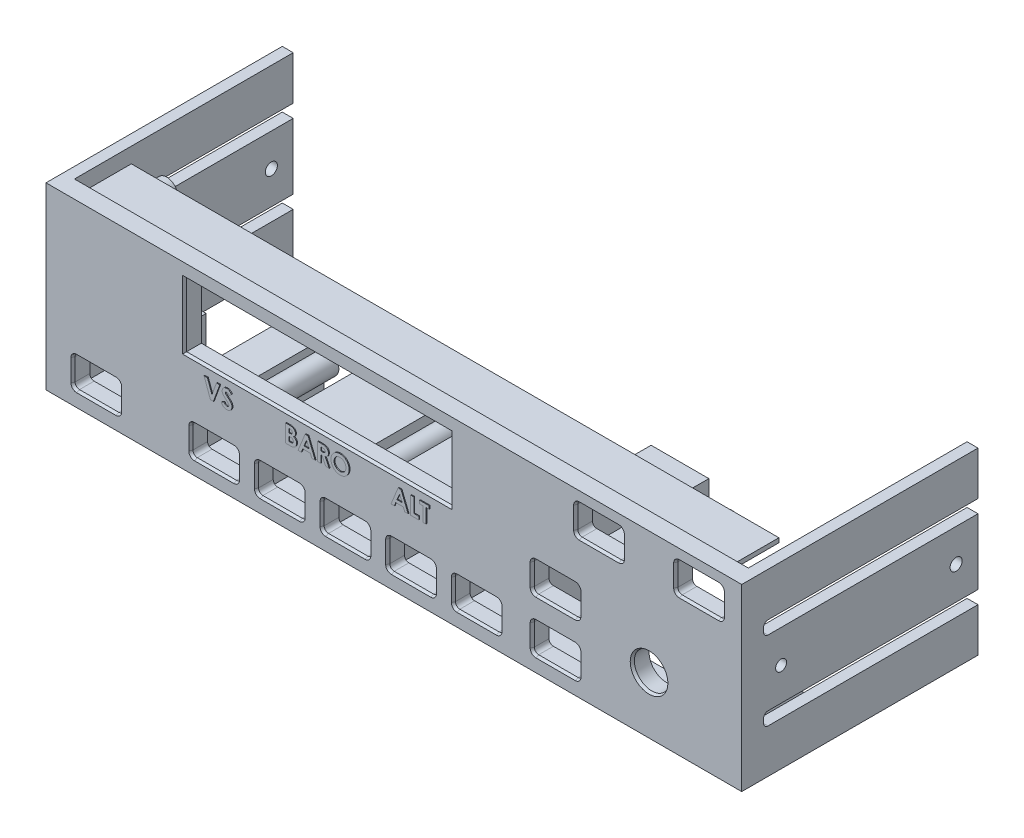
from build123d import *

# Parameters (mm, degrees)
ESQUISSE1_W             = 160
ESQUISSE1_H             = 41
BOSS_EXTRU_1_DEPTH      = 4
ESQUISSE2_R             = 4
ENL_V_MAT_EXTRU_1_DEPTH = 4
ESQUISSE4_W             = 3
ESQUISSE4_H             = 41
BOSS_EXTRU_2_DEPTH      = 50
ENL_V_MAT_EXTRU_2_DEPTH = 173.571724219
CHANFREIN1_SIZE         = 0.3
CHANFREIN1_SIZE2        = 0.643352076
ESQUISSE9_R             = 1.25
ESQUISSE9_R_2           = 1.375
ENL_V_MAT_EXTRU_3_DEPTH = 900
ESQUISSE10_W            = 4.171279912
ESQUISSE10_H            = 57.921201065
ESQUISSE10_W_2          = 8.342559824
ESQUISSE10_H_2          = 64.595248924
ENL_V_MAT_EXTRU_5_DEPTH = 174.772840225
ESQUISSE11_W            = 13.2
ESQUISSE11_H            = 12.9
ESQUISSE11_W_2          = 11.8
ESQUISSE11_H_2          = 11.5
BOSS_EXTRU_4_DEPTH      = 14.5
ESQUISSE7_R             = 2.5
ESQUISSE7_R_2           = 1.25
BOSS_EXTRU_3_DEPTH      = 15
ESQUISSE12_W            = 148
ESQUISSE12_H            = 1
BOSS_EXTRU_5_DEPTH      = 10
ENL_V_MAT_EXTRU_6_DEPTH = 0.2
BOSS_EXTRU_6_DEPTH      = 0.2
BOSS_EXTRU_6_2_DEPTH    = 0.2
BOSS_EXTRU_6_3_DEPTH    = 0.2
BOSS_EXTRU_6_4_DEPTH    = 0.2
BOSS_EXTRU_6_5_DEPTH    = 0.2
BOSS_EXTRU_6_6_DEPTH    = 0.2
BOSS_EXTRU_6_7_DEPTH    = 0.2
BOSS_EXTRU_6_8_DEPTH    = 0.2
BOSS_EXTRU_6_9_DEPTH    = 0.2
ESQUISSE14_W            = 8.279282425
ESQUISSE14_H            = 6.197970863
ESQUISSE14_W_2          = 6.879282425
ESQUISSE14_H_2          = 4.797970863
ESQUISSE14_W_3          = 16.678738338
ESQUISSE14_H_3          = 6.241410903
ESQUISSE14_W_4          = 15.278738338
ESQUISSE14_H_4          = 4.841410903
ESQUISSE14_W_5          = 11.14782764
ESQUISSE14_H_5          = 6.395979727
ESQUISSE14_W_6          = 9.74782764
ESQUISSE14_H_6          = 4.995979727
BOSS_EXTRU_7_DEPTH      = 14.5


with BuildPart() as part:
    # Esquisse1 → Boss.-Extru.1 (new body)
    with BuildSketch(Plane.XY):
        with Locations((80, 20.5)):
            Rectangle(ESQUISSE1_W, ESQUISSE1_H)
    extrude(amount=BOSS_EXTRU_1_DEPTH)

    # Esquisse2 → Enlèv. mat.-Extru.1 (cut)
    with BuildSketch(Plane.XY.offset(4)):
        with Locations((138.32, 13)):
            Circle(ESQUISSE2_R)
        with BuildLine():
            Line((7.5, 3.25), (16.5, 3.25))
            ThreePointArc((16.5, 3.25), (17.207106781, 3.542893219), (17.5, 4.25))
            Line((17.5, 4.25), (17.5, 9.25))
            ThreePointArc((17.5, 9.25), (17.207106781, 9.957106781), (16.5, 10.25))
            Line((16.5, 10.25), (7.5, 10.25))
            ThreePointArc((7.5, 10.25), (6.792893219, 9.957106781), (6.5, 9.25))
            Line((6.5, 9.25), (6.5, 4.25))
            ThreePointArc((6.5, 4.25), (6.792893219, 3.542893219), (7.5, 3.25))
        make_face()
        with BuildLine():
            Line((49.430194036, 10.25), (58.430194036, 10.25))
            ThreePointArc((58.430194036, 10.25), (59.137300817, 9.957106781), (59.430194036, 9.25))
            Line((59.430194036, 9.25), (59.430194036, 4.25))
            ThreePointArc((59.430194036, 4.25), (59.137300817, 3.542893219), (58.430194036, 3.25))
            Line((58.430194036, 3.25), (49.430194036, 3.25))
            ThreePointArc((49.430194036, 3.25), (48.723087255, 3.542893219), (48.430194036, 4.25))
            Line((48.430194036, 4.25), (48.430194036, 9.25))
            ThreePointArc((48.430194036, 9.25), (48.723087255, 9.957106781), (49.430194036, 10.25))
        make_face()
        with BuildLine():
            Line((34.430194036, 10.25), (43.430194036, 10.25))
            ThreePointArc((43.430194036, 10.25), (44.137300817, 9.957106781), (44.430194036, 9.25))
            Line((44.430194036, 9.25), (44.430194036, 4.25))
            ThreePointArc((44.430194036, 4.25), (44.137300817, 3.542893219), (43.430194036, 3.25))
            Line((43.430194036, 3.25), (34.430194036, 3.25))
            ThreePointArc((34.430194036, 3.25), (33.723087255, 3.542893219), (33.430194036, 4.25))
            Line((33.430194036, 4.25), (33.430194036, 9.25))
            ThreePointArc((33.430194036, 9.25), (33.723087255, 9.957106781), (34.430194036, 10.25))
        make_face()
        with BuildLine():
            Line((64.430194036, 10.25), (73.430194036, 10.25))
            ThreePointArc((73.430194036, 10.25), (74.137300817, 9.957106781), (74.430194036, 9.25))
            Line((74.430194036, 9.25), (74.430194036, 4.25))
            ThreePointArc((74.430194036, 4.25), (74.137300817, 3.542893219), (73.430194036, 3.25))
            Line((73.430194036, 3.25), (64.430194036, 3.25))
            ThreePointArc((64.430194036, 3.25), (63.723087255, 3.542893219), (63.430194036, 4.25))
            Line((63.430194036, 4.25), (63.430194036, 9.25))
            ThreePointArc((63.430194036, 9.25), (63.723087255, 9.957106781), (64.430194036, 10.25))
        make_face()
        with BuildLine():
            Line((79.430194036, 10.25), (88.430194036, 10.25))
            ThreePointArc((88.430194036, 10.25), (89.137300817, 9.957106781), (89.430194036, 9.25))
            Line((89.430194036, 9.25), (89.430194036, 4.25))
            ThreePointArc((89.430194036, 4.25), (89.137300817, 3.542893219), (88.430194036, 3.25))
            Line((88.430194036, 3.25), (79.430194036, 3.25))
            ThreePointArc((79.430194036, 3.25), (78.723087255, 3.542893219), (78.430194036, 4.25))
            Line((78.430194036, 4.25), (78.430194036, 9.25))
            ThreePointArc((78.430194036, 9.25), (78.723087255, 9.957106781), (79.430194036, 10.25))
        make_face()
        with BuildLine():
            Line((112.45409437, 10.25), (121.45409437, 10.25))
            ThreePointArc((121.45409437, 10.25), (122.161201151, 9.957106781), (122.45409437, 9.25))
            Line((122.45409437, 9.25), (122.45409437, 4.25))
            ThreePointArc((122.45409437, 4.25), (122.161201151, 3.542893219), (121.45409437, 3.25))
            Line((121.45409437, 3.25), (112.45409437, 3.25))
            ThreePointArc((112.45409437, 3.25), (111.746987589, 3.542893219), (111.45409437, 4.25))
            Line((111.45409437, 4.25), (111.45409437, 9.25))
            ThreePointArc((111.45409437, 9.25), (111.746987589, 9.957106781), (112.45409437, 10.25))
        make_face()
        with BuildLine():
            Line((122.389585492, 31.5), (131.389585492, 31.5))
            ThreePointArc((131.389585492, 31.5), (132.096692273, 31.792893219), (132.389585492, 32.5))
            Line((132.389585492, 32.5), (132.389585492, 37.5))
            ThreePointArc((132.389585492, 37.5), (132.096692273, 38.207106781), (131.389585492, 38.5))
            Line((131.389585492, 38.5), (122.389585492, 38.5))
            ThreePointArc((122.389585492, 38.5), (121.682478711, 38.207106781), (121.389585492, 37.5))
            Line((121.389585492, 37.5), (121.389585492, 32.5))
            ThreePointArc((121.389585492, 32.5), (121.682478711, 31.792893219), (122.389585492, 31.5))
        make_face()
        with BuildLine():
            Line((145.25, 31.5), (154.25, 31.5))
            ThreePointArc((154.25, 31.5), (154.957106781, 31.792893219), (155.25, 32.5))
            Line((155.25, 32.5), (155.25, 37.5))
            ThreePointArc((155.25, 37.5), (154.957106781, 38.207106781), (154.25, 38.5))
            Line((154.25, 38.5), (145.25, 38.5))
            ThreePointArc((145.25, 38.5), (144.542893219, 38.207106781), (144.25, 37.5))
            Line((144.25, 37.5), (144.25, 32.5))
            ThreePointArc((144.25, 32.5), (144.542893219, 31.792893219), (145.25, 31.5))
        make_face()
        with BuildLine():
            Line((112.45409437, 22.25), (121.45409437, 22.25))
            ThreePointArc((121.45409437, 22.25), (122.161201151, 21.957106781), (122.45409437, 21.25))
            Line((122.45409437, 21.25), (122.45409437, 16.25))
            ThreePointArc((122.45409437, 16.25), (122.161201151, 15.542893219), (121.45409437, 15.25))
            Line((121.45409437, 15.25), (112.45409437, 15.25))
            ThreePointArc((112.45409437, 15.25), (111.746987589, 15.542893219), (111.45409437, 16.25))
            Line((111.45409437, 16.25), (111.45409437, 21.25))
            ThreePointArc((111.45409437, 21.25), (111.746987589, 21.957106781), (112.45409437, 22.25))
        make_face()
        Polygon((32, 38), (63.5, 38), (93, 38), (93, 23), (63.5, 23), (32, 23), align=None)
        with BuildLine():
            Line((94.430194036, 10.25), (103.430194036, 10.25))
            ThreePointArc((103.430194036, 10.25), (104.137300817, 9.957106781), (104.430194036, 9.25))
            Line((104.430194036, 9.25), (104.430194036, 4.25))
            ThreePointArc((104.430194036, 4.25), (104.137300817, 3.542893219), (103.430194036, 3.25))
            Line((103.430194036, 3.25), (94.430194036, 3.25))
            ThreePointArc((94.430194036, 3.25), (93.723087255, 3.542893219), (93.430194036, 4.25))
            Line((93.430194036, 4.25), (93.430194036, 9.25))
            ThreePointArc((93.430194036, 9.25), (93.723087255, 9.957106781), (94.430194036, 10.25))
        make_face()
    extrude(amount=-ENL_V_MAT_EXTRU_1_DEPTH, mode=Mode.SUBTRACT)

    # Esquisse4 → Boss.-Extru.2 (add)
    with BuildSketch(Plane(origin=(0, 0, 0), x_dir=(-1, 0, 0), z_dir=(0, 0, -1))):
        with Locations((-158.5, 20.5)):
            Rectangle(ESQUISSE4_W, ESQUISSE4_H)
        with Locations((-1.5, 20.5)):
            Rectangle(ESQUISSE4_W, ESQUISSE4_H)
    extrude(amount=BOSS_EXTRU_2_DEPTH)

    # Esquisse5 → Enlèv. mat.-Extru.2 (cut, through all)
    with BuildSketch(Plane(origin=(160, 0, 0), x_dir=(0, 0, -1), z_dir=(1, 0, 0))):
        with BuildLine():
            Line((50, 13), (2, 13))
            ThreePointArc((2, 13), (1.292893219, 12.707106781), (1, 12))
            Line((1, 12), (1, 11))
            ThreePointArc((1, 11), (1.292893219, 10.292893219), (2, 10))
            Line((2, 10), (50, 10))
            Line((50, 10), (50, 13))
        make_face()
        with BuildLine():
            Line((50, 31), (2, 31))
            ThreePointArc((2, 31), (1.292893219, 30.707106781), (1, 30))
            Line((1, 30), (1, 29))
            ThreePointArc((1, 29), (1.292893219, 28.292893219), (2, 28))
            Line((2, 28), (50, 28))
            Line((50, 28), (50, 31))
        make_face()
    extrude(amount=-ENL_V_MAT_EXTRU_2_DEPTH, mode=Mode.SUBTRACT)

    # Chanfrein1
    chanfrein1_edges = [part.edges().sort_by_distance(p)[0] for p in [
        (93, 30.5, 4),
        (62.5, 23, 4),
        (32, 30.5, 4),
        (62.5, 38, 4),
        (149.75, 31.5, 4),
        (154.957106781, 31.792893219, 4),
        (144.542893219, 31.792893219, 4),
        (155.25, 35, 4),
        (144.25, 35, 4),
        (154.957106781, 38.207106781, 4),
        (144.542893219, 38.207106781, 4),
        (149.75, 38.5, 4),
        (126.889585492, 31.5, 4),
        (132.096692273, 31.792893219, 4),
        (121.682478711, 31.792893219, 4),
        (132.389585492, 35, 4),
        (121.389585492, 35, 4),
        (132.096692273, 38.207106781, 4),
        (121.682478711, 38.207106781, 4),
        (126.889585492, 38.5, 4),
        (12, 3.25, 4),
        (17.207106781, 3.542893219, 4),
        (6.792893219, 3.542893219, 4),
        (17.5, 6.75, 4),
        (6.5, 6.75, 4),
        (17.207106781, 9.957106781, 4),
        (6.792893219, 9.957106781, 4),
        (12, 10.25, 4),
        (134.32, 13, 4),
        (122.45409437, 18.75, 4),
        (122.161201151, 21.957106781, 4),
        (122.161201151, 15.542893219, 4),
        (116.95409437, 22.25, 4),
        (116.95409437, 15.25, 4),
        (111.746987589, 21.957106781, 4),
        (111.746987589, 15.542893219, 4),
        (111.45409437, 18.75, 4),
        (122.45409437, 6.75, 4),
        (122.161201151, 9.957106781, 4),
        (122.161201151, 3.542893219, 4),
        (116.95409437, 10.25, 4),
        (116.95409437, 3.25, 4),
        (111.746987589, 9.957106781, 4),
        (111.746987589, 3.542893219, 4),
        (111.45409437, 6.75, 4),
        (104.430194036, 6.75, 4),
        (104.137300817, 9.957106781, 4),
        (104.137300817, 3.542893219, 4),
        (98.930194036, 10.25, 4),
        (98.930194036, 3.25, 4),
        (93.723087255, 9.957106781, 4),
        (93.723087255, 3.542893219, 4),
        (93.430194036, 6.75, 4),
        (89.430194036, 6.75, 4),
        (89.137300817, 9.957106781, 4),
        (89.137300817, 3.542893219, 4),
        (83.930194036, 10.25, 4),
        (83.930194036, 3.25, 4),
        (78.723087255, 9.957106781, 4),
        (78.723087255, 3.542893219, 4),
        (78.430194036, 6.75, 4),
        (74.430194036, 6.75, 4),
        (74.137300817, 9.957106781, 4),
        (74.137300817, 3.542893219, 4),
        (68.930194036, 10.25, 4),
        (68.930194036, 3.25, 4),
        (63.723087255, 9.957106781, 4),
        (63.723087255, 3.542893219, 4),
        (63.430194036, 6.75, 4),
        (59.430194036, 6.75, 4),
        (59.137300817, 9.957106781, 4),
        (59.137300817, 3.542893219, 4),
        (53.930194036, 10.25, 4),
        (53.930194036, 3.25, 4),
        (48.723087255, 9.957106781, 4),
        (48.723087255, 3.542893219, 4),
        (48.430194036, 6.75, 4),
        (44.430194036, 6.75, 4),
        (44.137300817, 9.957106781, 4),
        (44.137300817, 3.542893219, 4),
        (38.930194036, 10.25, 4),
        (38.930194036, 3.25, 4),
        (33.723087255, 9.957106781, 4),
        (33.723087255, 3.542893219, 4),
        (33.430194036, 6.75, 4),
    ]]
    chanfrein1_side = [part.faces().sort_by_distance(p)[0] for p in [
        (81.647811434, 19.771879368, 4),
    ]]
    chamfer(chanfrein1_edges, length=CHANFREIN1_SIZE, length2=CHANFREIN1_SIZE2, reference=chanfrein1_side[0])

    # Esquisse9 → Enlèv. mat.-Extru.3 (cut)
    with BuildSketch(Plane(origin=(160, 0, 0), x_dir=(0, 0, -1), z_dir=(1, 0, 0))):
        with Locations((5, 20.5)):
            Circle(ESQUISSE9_R)
        with Locations((45, 20.5)):
            Circle(ESQUISSE9_R_2)
    extrude(amount=-ENL_V_MAT_EXTRU_3_DEPTH, mode=Mode.SUBTRACT)

    # Esquisse10 → Enlèv. mat.-Extru.5 (cut, through all)
    with BuildSketch(Plane.XY.offset(4)):
        with Locations((-1.585639956, 24.108169502)):
            Rectangle(ESQUISSE10_W, ESQUISSE10_H)
        with Locations((163.671279912, 22.797195815)):
            Rectangle(ESQUISSE10_W_2, ESQUISSE10_H_2)
    extrude(amount=-ENL_V_MAT_EXTRU_5_DEPTH, mode=Mode.SUBTRACT)

    # Esquisse11 → Boss.-Extru.4 (add)
    # profile 1 of 7: a face of its own
    with BuildSketch(Plane(origin=(0, 0, 0), x_dir=(-1, 0, 0), z_dir=(0, 0, -1))):
        with Locations((-12, 8.5)):
            Rectangle(ESQUISSE11_W, ESQUISSE11_H)
        with Locations((-12, 8.5)):
            Rectangle(ESQUISSE11_W_2, ESQUISSE11_H_2, mode=Mode.SUBTRACT)
    # profile 2 of 7: a face of its own
    with BuildSketch(Plane(origin=(0, 0, 0), x_dir=(-1, 0, 0), z_dir=(0, 0, -1))):
        with Locations((-38.930194036, 8.5)):
            Rectangle(ESQUISSE11_W, ESQUISSE11_H)
        with Locations((-38.930194036, 8.5)):
            Rectangle(ESQUISSE11_W_2, ESQUISSE11_H_2, mode=Mode.SUBTRACT)
    # profile 3 of 7: a face of its own
    with BuildSketch(Plane(origin=(0, 0, 0), x_dir=(-1, 0, 0), z_dir=(0, 0, -1))):
        with Locations((-53.930194036, 8.5)):
            Rectangle(ESQUISSE11_W, ESQUISSE11_H)
        with Locations((-53.930194036, 8.5)):
            Rectangle(ESQUISSE11_W_2, ESQUISSE11_H_2, mode=Mode.SUBTRACT)
    # profile 4 of 7: a face of its own
    with BuildSketch(Plane(origin=(0, 0, 0), x_dir=(-1, 0, 0), z_dir=(0, 0, -1))):
        with Locations((-68.930194036, 8.5)):
            Rectangle(ESQUISSE11_W, ESQUISSE11_H)
        with Locations((-68.930194036, 8.5)):
            Rectangle(ESQUISSE11_W_2, ESQUISSE11_H_2, mode=Mode.SUBTRACT)
    # profile 5 of 7: a face of its own
    with BuildSketch(Plane(origin=(0, 0, 0), x_dir=(-1, 0, 0), z_dir=(0, 0, -1))):
        with Locations((-83.930194036, 8.5)):
            Rectangle(ESQUISSE11_W, ESQUISSE11_H)
        with Locations((-83.930194036, 8.5)):
            Rectangle(ESQUISSE11_W_2, ESQUISSE11_H_2, mode=Mode.SUBTRACT)
    # profile 6 of 7: a face of its own
    with BuildSketch(Plane(origin=(0, 0, 0), x_dir=(-1, 0, 0), z_dir=(0, 0, -1))):
        with Locations((-98.930194036, 8.5)):
            Rectangle(ESQUISSE11_W, ESQUISSE11_H)
        with Locations((-98.930194036, 8.5)):
            Rectangle(ESQUISSE11_W_2, ESQUISSE11_H_2, mode=Mode.SUBTRACT)
    # profile 7 of 7: a face of its own
    with BuildSketch(Plane(origin=(0, 0, 0), x_dir=(-1, 0, 0), z_dir=(0, 0, -1))):
        with Locations((-126.889585492, 33.25)):
            Rectangle(ESQUISSE11_W, ESQUISSE11_H)
        with Locations((-126.889585492, 33.25)):
            Rectangle(ESQUISSE11_W_2, ESQUISSE11_H_2, mode=Mode.SUBTRACT)
    extrude(amount=BOSS_EXTRU_4_DEPTH)

    # Esquisse7 → Boss.-Extru.3 (add)
    # profile 1 of 7: a face of its own
    with BuildSketch(Plane(origin=(0, 0, 0), x_dir=(-1, 0, 0), z_dir=(0, 0, -1))):
        with Locations((-9.121504758, 34.424873109)):
            Circle(ESQUISSE7_R)
        with Locations((-9.121504758, 34.424873109)):
            Circle(ESQUISSE7_R_2, mode=Mode.SUBTRACT)
    # profile 2 of 7: a face of its own
    with BuildSketch(Plane(origin=(0, 0, 0), x_dir=(-1, 0, 0), z_dir=(0, 0, -1))):
        with Locations((-24.98168427, 6.75)):
            Circle(ESQUISSE7_R)
        with Locations((-24.98168427, 6.75)):
            Circle(ESQUISSE7_R_2, mode=Mode.SUBTRACT)
    # profile 3 of 7: a face of its own
    with BuildSketch(Plane(origin=(0, 0, 0), x_dir=(-1, 0, 0), z_dir=(0, 0, -1))):
        with Locations((-138.246159037, 33.067084724)):
            Circle(ESQUISSE7_R)
        with Locations((-138.246159037, 33.067084724)):
            Circle(ESQUISSE7_R_2, mode=Mode.SUBTRACT)
    # profile 4 of 7: a face of its own
    with BuildSketch(Plane(origin=(0, 0, 0), x_dir=(-1, 0, 0), z_dir=(0, 0, -1))):
        with Locations((-152.183195484, 6.75)):
            Circle(ESQUISSE7_R)
        with Locations((-152.183195484, 6.75)):
            Circle(ESQUISSE7_R_2, mode=Mode.SUBTRACT)
    # profile 5 of 7: a face of its own
    with BuildSketch(Plane(origin=(0, 0, 0), x_dir=(-1, 0, 0), z_dir=(0, 0, -1))):
        with Locations((-73.299586821, 18.635920155)):
            Circle(ESQUISSE7_R)
        with Locations((-73.299586821, 18.635920155)):
            Circle(ESQUISSE7_R_2, mode=Mode.SUBTRACT)
    # profile 6 of 7: a face of its own
    with BuildSketch(Plane(origin=(0, 0, 0), x_dir=(-1, 0, 0), z_dir=(0, 0, -1))):
        with Locations((-103.528260194, 18.635920155)):
            Circle(ESQUISSE7_R)
        with Locations((-103.528260194, 18.635920155)):
            Circle(ESQUISSE7_R_2, mode=Mode.SUBTRACT)
    # profile 7 of 7: a face of its own
    with BuildSketch(Plane(origin=(0, 0, 0), x_dir=(-1, 0, 0), z_dir=(0, 0, -1))):
        with Locations((-45.928753513, 18.635920155)):
            Circle(ESQUISSE7_R)
        with Locations((-45.928753513, 18.635920155)):
            Circle(ESQUISSE7_R_2, mode=Mode.SUBTRACT)
    extrude(amount=BOSS_EXTRU_3_DEPTH)

    # Esquisse12 → Boss.-Extru.5 (add)
    with BuildSketch(Plane(origin=(0, 0, 0), x_dir=(-1, 0, 0), z_dir=(0, 0, -1))):
        with Locations((-80, 40)):
            Rectangle(ESQUISSE12_W, ESQUISSE12_H)
        with Locations((-80, 1)):
            Rectangle(ESQUISSE12_W, ESQUISSE12_H)
    extrude(amount=BOSS_EXTRU_5_DEPTH)

    # Esquisse13 → Enlèv. mat.-Extru.6 (cut)
    # profile 1 of 9: a face of its own
    with BuildSketch(Plane.XY.offset(4)):
        Polygon((36.828205128, 21.061183811), (37.595032051, 21.061183811), (38.623076923, 18.219837658), (39.653525641, 21.061183811), (40.417948718, 21.061183811), (38.967628205, 17.061183811), (38.276121795, 17.061183811), align=None)
    # profile 2 of 9: a face of its own
    with BuildSketch(Plane.XY.offset(4)):
        with BuildLine():
            Line((43.11025641, 20.526728683), (42.573397436, 20.035542786))
            add(Edge.make_bspline(
                [(42.573397436, 20.035542786), (42.550400699, 20.067982073), (42.506250172, 20.130260982), (42.434686773, 20.213653908), (42.363446519, 20.28479428), (42.291869413, 20.343384906), (42.219321023, 20.389069805), (42.145927282, 20.421415218), (42.072104279, 20.441977504), (42.022506616, 20.444538003), (41.998076923, 20.445799196)],
                knots=[0, 0, 0, 0, 1.299362458, 2.494594718, 3.587462134, 4.587049575, 5.512617175, 6.380583204, 7.202344345, 8, 8, 8, 8], degree=3))
            add(Edge.make_bspline(
                [(41.998076923, 20.445799196), (41.975289606, 20.445000046), (41.931293283, 20.443457099), (41.868573261, 20.428120311), (41.812889533, 20.401651269), (41.764296442, 20.367040768), (41.725803545, 20.32534314), (41.695069952, 20.281613049), (41.677764356, 20.233344918), (41.675486599, 20.200192419), (41.674358974, 20.183779965)],
                knots=[0, 0, 0, 0, 1.185010067, 2.2879431, 3.333075148, 4.379039566, 5.372662701, 6.27520591, 7.14612461, 8, 8, 8, 8], degree=3))
            add(Edge.make_bspline(
                [(41.674358974, 20.183779965), (41.6750656, 20.167130837), (41.676488645, 20.133601805), (41.690233323, 20.084460834), (41.710950479, 20.036444385), (41.730746567, 20.007214488), (41.740865385, 19.992273555)],
                knots=[0, 0, 0, 0, 0.967525499, 1.948461899, 2.951351359, 4, 4, 4, 4], degree=3))
            add(Edge.make_bspline(
                [(41.740865385, 19.992273555), (41.750064485, 19.980660125), (41.771239598, 19.953927541), (41.811616203, 19.911587297), (41.862320739, 19.859716791), (41.925304423, 19.800099698), (41.997952629, 19.730591956), (42.083632696, 19.653925939), (42.179878378, 19.567727389), (42.248287579, 19.507701841), (42.284134615, 19.476247914)],
                knots=[0, 0, 0, 0, 0.473873513, 1.090794244, 1.870441696, 2.795289791, 3.865433203, 5.087734844, 6.473946851, 8, 8, 8, 8], degree=3))
            add(Edge.make_bspline(
                [(42.284134615, 19.476247914), (42.317782216, 19.447127613), (42.381638371, 19.391863331), (42.472492999, 19.313424557), (42.552339086, 19.242855104), (42.622339806, 19.18121407), (42.681434017, 19.127854698), (42.729870152, 19.082521931), (42.768239774, 19.046098316), (42.790050658, 19.02409843), (42.799358974, 19.014709452)],
                knots=[0, 0, 0, 0, 1.543621617, 2.929473131, 4.163658386, 5.240097082, 6.164993805, 6.925417477, 7.541396219, 8, 8, 8, 8], degree=3))
            add(Edge.make_bspline(
                [(42.799358974, 19.014709452), (42.834672785, 18.976492346), (42.902558331, 18.903025646), (42.99078561, 18.789175366), (43.063399514, 18.678034279), (43.119575007, 18.567511083), (43.162000999, 18.45601115), (43.191911886, 18.34079995), (43.209825715, 18.220673598), (43.211814568, 18.138702028), (43.212820513, 18.097241504)],
                knots=[0, 0, 0, 0, 1.206664779, 2.319633467, 3.337109185, 4.282041471, 5.190008762, 6.099243693, 7.03861361, 8, 8, 8, 8], degree=3))
            add(Edge.make_bspline(
                [(43.212820513, 18.097241504), (43.212104507, 18.056843308), (43.210699677, 17.977580544), (43.193493199, 17.861591295), (43.168957772, 17.750584551), (43.131021698, 17.64576822), (43.084785436, 17.545421775), (43.026821603, 17.451108295), (42.95875103, 17.361873288), (42.880731701, 17.279311939), (42.794433059, 17.204393238), (42.701869563, 17.13769884), (42.602136082, 17.08263412), (42.496084722, 17.03729225), (42.383772251, 17.002369336), (42.265332466, 16.976558048), (42.140584206, 16.961066519), (42.055279548, 16.959447064), (42.011698718, 16.958619709)],
                knots=[0, 0, 0, 0, 1.043214005, 2.046824704, 3.02475056, 3.976699089, 4.921714032, 5.875962561, 6.831408892, 7.817874052, 8.806269674, 9.781291748, 10.760897367, 11.74438705, 12.757449933, 13.795994037, 14.874007457, 16, 16, 16, 16], degree=3))
            add(Edge.make_bspline(
                [(42.011698718, 16.958619709), (41.977488138, 16.959226627), (41.909731569, 16.960428674), (41.80986863, 16.970242385), (41.713439674, 16.986080669), (41.620553319, 17.008781662), (41.530791095, 17.0375469), (41.444149317, 17.072682535), (41.361226101, 17.114733158), (41.281394011, 17.16283404), (41.205041129, 17.2186855), (41.131202003, 17.281145673), (41.060610074, 17.351175225), (40.992926303, 17.428608538), (40.928583749, 17.513664885), (40.865476249, 17.6051597), (40.806408492, 17.704791), (40.769919711, 17.774683164), (40.751282051, 17.810382529)],
                knots=[0, 0, 0, 0, 1.016823716, 2.013894106, 2.979844003, 3.91962641, 4.853723003, 5.779685073, 6.695824784, 7.614987388, 8.547259901, 9.504950863, 10.487499108, 11.500346958, 12.559593716, 13.656357062, 14.802919212, 16, 16, 16, 16], degree=3))
            Line((40.751282051, 17.810382529), (41.382692308, 18.18938894))
            add(Edge.make_bspline(
                [(41.382692308, 18.18938894), (41.406005234, 18.148865495), (41.450698107, 18.071178589), (41.526434357, 17.966796385), (41.604022279, 17.877410305), (41.685255637, 17.804600254), (41.769146661, 17.74739267), (41.856100567, 17.706508161), (41.946178446, 17.681200696), (42.007535405, 17.67811007), (42.038141026, 17.676568427)],
                knots=[0, 0, 0, 0, 1.283663364, 2.460892379, 3.537111102, 4.529833553, 5.449777664, 6.316464042, 7.160231139, 8, 8, 8, 8], degree=3))
            add(Edge.make_bspline(
                [(42.038141026, 17.676568427), (42.069271324, 17.677827416), (42.129668636, 17.680270039), (42.215878071, 17.702831807), (42.294918145, 17.738255438), (42.363239801, 17.788800075), (42.421090272, 17.847136268), (42.46378724, 17.91203795), (42.490609763, 17.982260004), (42.493445554, 18.031040861), (42.494871795, 18.055574837)],
                knots=[0, 0, 0, 0, 1.13588714, 2.203786484, 3.234766741, 4.283437687, 5.291419208, 6.222934724, 7.106237994, 8, 8, 8, 8], degree=3))
            add(Edge.make_bspline(
                [(42.494871795, 18.055574837), (42.49355472, 18.078399709), (42.490879209, 18.124766252), (42.47117222, 18.193705846), (42.440364184, 18.262614088), (42.403916106, 18.319134491), (42.366825622, 18.366457493), (42.331358753, 18.407460734), (42.28816949, 18.452762137), (42.23736734, 18.502418687), (42.179623533, 18.556867524), (42.114889427, 18.616103316), (42.042423748, 18.679604266), (41.991204863, 18.722860486), (41.964423077, 18.745478683)],
                knots=[0, 0, 0, 0, 0.916159276, 1.861089862, 2.860218735, 3.940849679, 4.552606315, 5.27541173, 6.11797699, 7.06649574, 8.129236253, 9.306560635, 10.591630461, 12, 12, 12, 12], degree=3))
            add(Edge.make_bspline(
                [(41.964423077, 18.745478683), (41.913509835, 18.788556168), (41.815791914, 18.871234899), (41.677704094, 18.993348783), (41.553274605, 19.107475396), (41.443578151, 19.215025594), (41.347217032, 19.314013173), (41.264843846, 19.405242148), (41.197363501, 19.489416227), (41.126354988, 19.58911479), (41.058882704, 19.71060434), (41.000567503, 19.856770351), (40.962735063, 20.002917817), (40.958496464, 20.101033176), (40.956410256, 20.149324837)],
                knots=[0, 0, 0, 0, 1.345494975, 2.582412109, 3.71882943, 4.751509156, 5.681369928, 6.505683931, 7.230279997, 7.856715994, 8.973648664, 10.023341002, 11.027102913, 12, 12, 12, 12], degree=3))
            add(Edge.make_bspline(
                [(40.956410256, 20.149324837), (40.957277907, 20.183570691), (40.958987273, 20.251038703), (40.974235075, 20.350240583), (40.997023497, 20.445962062), (41.030118828, 20.537853905), (41.073072572, 20.625801012), (41.125238225, 20.710233923), (41.187425822, 20.790375536), (41.257507045, 20.866172722), (41.33471861, 20.935442725), (41.417228979, 20.996580443), (41.504571137, 21.048218248), (41.596210768, 21.091055558), (41.692715724, 21.123844797), (41.79337506, 21.147087444), (41.898333151, 21.160911429), (41.969723379, 21.162790639), (42.006089744, 21.163747914)],
                knots=[0, 0, 0, 0, 1.010766082, 1.991317756, 2.957454644, 3.913069143, 4.869106762, 5.843196583, 6.838735724, 7.860187025, 8.887984031, 9.89767229, 10.887916223, 11.879572884, 12.879850636, 13.892031539, 14.926195476, 16, 16, 16, 16], degree=3))
            add(Edge.make_bspline(
                [(42.006089744, 21.163747914), (42.053218752, 21.162023834), (42.14710475, 21.158589285), (42.285917905, 21.131732227), (42.421504791, 21.089496676), (42.530763245, 21.03854413), (42.617698158, 20.989186374), (42.684325647, 20.94374397), (42.752122704, 20.891687254), (42.82163607, 20.832852182), (42.891574078, 20.766130222), (42.9639254, 20.693109745), (43.037704163, 20.613159683), (43.08564866, 20.556043729), (43.11025641, 20.526728683)],
                knots=[0, 0, 0, 0, 1.282922637, 2.555718331, 3.837320111, 5.142675274, 5.830281639, 6.55870424, 7.337177975, 8.157850921, 9.037902056, 9.96903443, 10.957596896, 12, 12, 12, 12], degree=3))
        make_face()
    # profile 3 of 9: a face of its own
    with BuildSketch(Plane.XY.offset(4)):
        with BuildLine():
            Line((55.461538462, 17.061183811), (55.461538462, 21.061183811))
            Line((55.461538462, 21.061183811), (56.102564103, 21.061183811))
            add(Edge.make_bspline(
                [(56.102564103, 21.061183811), (56.147439906, 21.061188933), (56.234273734, 21.061198843), (56.359552286, 21.056799471), (56.475737563, 21.051108391), (56.582459819, 21.044741397), (56.679900701, 21.033769792), (56.767912036, 21.02220692), (56.84666967, 21.008262808), (56.895361235, 20.995754508), (56.918269231, 20.989869709)],
                knots=[0, 0, 0, 0, 1.311965854, 2.538629056, 3.664479157, 4.713267157, 5.663616078, 6.530575999, 7.308677837, 8, 8, 8, 8], degree=3))
            add(Edge.make_bspline(
                [(56.918269231, 20.989869709), (56.948349755, 20.981569095), (57.007377399, 20.965280625), (57.091923823, 20.932385358), (57.1721279, 20.895819935), (57.247891703, 20.854105627), (57.318750011, 20.806738824), (57.38443354, 20.75334361), (57.446358919, 20.696063266), (57.502327322, 20.633301405), (57.552913536, 20.566981873), (57.596863886, 20.497122047), (57.635051108, 20.42479013), (57.665610887, 20.349075873), (57.688637107, 20.27032796), (57.705478388, 20.188882657), (57.716393819, 20.104482251), (57.717425184, 20.047061897), (57.717948718, 20.017914581)],
                knots=[0, 0, 0, 0, 1.099996261, 2.158545794, 3.195537121, 4.207578794, 5.205712374, 6.197378256, 7.190519799, 8.17788031, 9.159561366, 10.129234751, 11.085776129, 12.040971148, 13.00380137, 13.975669004, 14.972423361, 16, 16, 16, 16], degree=3))
            add(Edge.make_bspline(
                [(57.717948718, 20.017914581), (57.716579831, 19.98046793), (57.713885346, 19.9067588), (57.696672793, 19.798493424), (57.664396574, 19.696167082), (57.622163926, 19.597893938), (57.564740728, 19.504040552), (57.491824373, 19.414651549), (57.404595866, 19.326974508), (57.337686786, 19.274418035), (57.302884615, 19.247081247)],
                knots=[0, 0, 0, 0, 0.986156485, 1.941127874, 2.875419072, 3.804401753, 4.751181392, 5.761612777, 6.835722519, 8, 8, 8, 8], degree=3))
            add(Edge.make_bspline(
                [(57.302884615, 19.247081247), (57.331086625, 19.232684366), (57.386382964, 19.204456065), (57.46488752, 19.158057164), (57.537574169, 19.108706048), (57.604768817, 19.057395682), (57.665061978, 19.001950944), (57.720943259, 18.945566638), (57.769655767, 18.885012175), (57.81321596, 18.822445833), (57.851077771, 18.756961644), (57.884051234, 18.688670196), (57.911902735, 18.61733819), (57.935488107, 18.543328649), (57.953078084, 18.466387014), (57.964547122, 18.386485768), (57.973328535, 18.303897415), (57.974011647, 18.247640291), (57.974358974, 18.219036376)],
                knots=[0, 0, 0, 0, 1.164658916, 2.283573913, 3.35186032, 4.395461096, 5.390182219, 6.362969632, 7.312859996, 8.245001507, 9.165155236, 10.092416118, 11.032087915, 11.979892451, 12.947605196, 13.931445124, 14.948243989, 16, 16, 16, 16], degree=3))
            add(Edge.make_bspline(
                [(57.974358974, 18.219036376), (57.972105049, 18.164404533), (57.967656937, 18.056588811), (57.935134514, 17.898290569), (57.878750965, 17.748209479), (57.803039485, 17.606942025), (57.709748376, 17.47857767), (57.602490352, 17.36613161), (57.482345258, 17.270948516), (57.371496886, 17.206707311), (57.275621775, 17.163595456), (57.196210211, 17.136940988), (57.110923875, 17.11224833), (57.018200525, 17.094908635), (56.91972111, 17.079037439), (56.814525449, 17.069238235), (56.702810151, 17.062597555), (56.626079255, 17.061664587), (56.586538462, 17.061183811)],
                knots=[0, 0, 0, 0, 1.284142165, 2.534249414, 3.780121997, 5.041676246, 6.291546858, 7.49970053, 8.684500223, 9.883330709, 10.50184324, 11.153274765, 11.851151195, 12.587658647, 13.369265475, 14.195992086, 15.070362669, 16, 16, 16, 16], degree=3))
            Line((56.586538462, 17.061183811), (55.461538462, 17.061183811))
        make_face()
        with BuildLine():
            Line((56.179487179, 20.343235093), (56.179487179, 19.471440222))
            Line((56.179487179, 19.471440222), (56.370192308, 19.471440222))
            add(Edge.make_bspline(
                [(56.370192308, 19.471440222), (56.396110848, 19.471666241), (56.446145022, 19.472102558), (56.518414078, 19.477722169), (56.585612629, 19.487309573), (56.647485806, 19.500686414), (56.70460998, 19.517673052), (56.756620224, 19.538111636), (56.803287859, 19.563048929), (56.857504858, 19.600194129), (56.914816136, 19.654854952), (56.965266609, 19.733823837), (56.9949816, 19.824637754), (56.998291049, 19.888686761), (57, 19.921760735)],
                knots=[0, 0, 0, 0, 1.065314748, 2.056525647, 2.977365736, 3.853934255, 4.656397591, 5.425096493, 6.14721249, 6.826394842, 8.123232004, 9.372140726, 10.643011755, 12, 12, 12, 12], degree=3))
            add(Edge.make_bspline(
                [(57, 19.921760735), (56.998632526, 19.952740006), (56.995988571, 20.012637183), (56.966069395, 20.096738153), (56.919598999, 20.171268825), (56.864734166, 20.222278975), (56.813068264, 20.257117404), (56.768828748, 20.280057026), (56.720272558, 20.300592341), (56.666459697, 20.316294143), (56.607697466, 20.328076222), (56.544271307, 20.336728749), (56.476071787, 20.342618026), (56.428966234, 20.343024992), (56.404647436, 20.343235093)],
                knots=[0, 0, 0, 0, 1.347982417, 2.606269829, 3.849316587, 5.153353503, 5.842674298, 6.568177932, 7.326619318, 8.142485038, 9.012069166, 9.942760135, 10.937925643, 12, 12, 12, 12], degree=3))
            Line((56.404647436, 20.343235093), (56.179487179, 20.343235093))
        make_face(mode=Mode.SUBTRACT)
        with BuildLine():
            Line((56.179487179, 18.804773555), (56.179487179, 17.779132529))
            Line((56.179487179, 17.779132529), (56.386217949, 17.779132529))
            add(Edge.make_bspline(
                [(56.386217949, 17.779132529), (56.427088885, 17.779366024), (56.50566836, 17.779814945), (56.618233319, 17.785238986), (56.720583008, 17.795014864), (56.812446238, 17.807219259), (56.893963717, 17.823754307), (56.964859895, 17.844776501), (57.026107021, 17.867904576), (57.077337855, 17.896470494), (57.119190512, 17.929714139), (57.156958146, 17.963689943), (57.187751522, 18.002884243), (57.212115816, 18.045614535), (57.233203069, 18.09081937), (57.245921411, 18.140263979), (57.25560471, 18.192482943), (57.256137608, 18.228601671), (57.256410256, 18.247081247)],
                knots=[0, 0, 0, 0, 1.753078804, 3.370512758, 4.83203934, 6.162291463, 7.344201807, 8.395507345, 9.331626367, 10.147333109, 10.898971645, 11.62040215, 12.321813352, 13.025280112, 13.727906689, 14.453419512, 15.208716525, 16, 16, 16, 16], degree=3))
            add(Edge.make_bspline(
                [(57.256410256, 18.247081247), (57.255808988, 18.268212934), (57.254637878, 18.309371774), (57.245073409, 18.369529812), (57.227691645, 18.425691332), (57.205798466, 18.47929246), (57.175332943, 18.528414089), (57.139125711, 18.574756131), (57.095378131, 18.616749303), (57.046181425, 18.656933508), (56.988798338, 18.692116957), (56.923201948, 18.722644831), (56.8490359, 18.748140587), (56.766070456, 18.768440325), (56.67466933, 18.785668431), (56.574165395, 18.795955513), (56.465395682, 18.803606468), (56.389972993, 18.804375686), (56.350961538, 18.804773555)],
                knots=[0, 0, 0, 0, 0.845221588, 1.646264278, 2.427170338, 3.19324141, 3.95557735, 4.731569926, 5.540061037, 6.376114724, 7.268642756, 8.224665384, 9.265483498, 10.400594375, 11.639216012, 12.983232105, 14.439614077, 16, 16, 16, 16], degree=3))
            Line((56.350961538, 18.804773555), (56.179487179, 18.804773555))
        make_face(mode=Mode.SUBTRACT)
    # profile 4 of 9: a face of its own
    with BuildSketch(Plane.XY.offset(4)):
        Polygon((59.923878205, 21.061183811), (60.58974359, 21.061183811), (62.205128205, 17.061183811), (61.438301282, 17.061183811), (61.127403846, 17.881696632), (59.384615385, 17.881696632), (59.073717949, 17.061183811), (58.307692308, 17.061183811), align=None)
        Polygon((60.256410256, 19.988267145), (59.657051282, 18.59964535), (60.855769231, 18.59964535), align=None, mode=Mode.SUBTRACT)
    # profile 5 of 9: a face of its own
    with BuildSketch(Plane.XY.offset(4)):
        with BuildLine():
            Line((62.794871795, 21.061183811), (63.631410256, 21.061183811))
            add(Edge.make_bspline(
                [(63.631410256, 21.061183811), (63.686705194, 21.060987546), (63.793052935, 21.060610073), (63.946400569, 21.054654542), (64.087271459, 21.046366931), (64.215874178, 21.033719818), (64.332153707, 21.016951274), (64.436226586, 20.997183936), (64.528089773, 20.974654817), (64.608518006, 20.946581756), (64.68110051, 20.914915769), (64.748757494, 20.87853097), (64.812981572, 20.837832514), (64.873343477, 20.791749515), (64.930367766, 20.741110996), (64.98416202, 20.685865982), (65.033966075, 20.625546019), (65.079471544, 20.560532254), (65.120946116, 20.492139263), (65.157600939, 20.420273143), (65.187408702, 20.344883917), (65.213747056, 20.26706112), (65.232717719, 20.185692262), (65.245911537, 20.101569481), (65.255571535, 20.014396657), (65.256126939, 19.955175311), (65.256410256, 19.924965863)],
                knots=[0, 0, 0, 0, 1.749336639, 3.364467119, 4.854658419, 6.213483162, 7.451590619, 8.570285859, 9.5643256, 10.440900261, 11.26203566, 12.067320669, 12.869050712, 13.665104639, 14.467235401, 15.27997916, 16.102287765, 16.939272006, 17.78853747, 18.631303466, 19.488103222, 20.351255419, 21.228522269, 22.127379805, 23.044756219, 24, 24, 24, 24], degree=3))
            add(Edge.make_bspline(
                [(65.256410256, 19.924965863), (65.2556743, 19.893434139), (65.254231223, 19.831606175), (65.246458024, 19.740785938), (65.232251059, 19.653895488), (65.210732545, 19.57118923), (65.185999807, 19.491637787), (65.153111609, 19.416708934), (65.115994028, 19.345312938), (65.071910562, 19.278459724), (65.023531111, 19.214664348), (64.967266827, 19.156371046), (64.906762772, 19.100446776), (64.838617792, 19.050394444), (64.765835782, 19.002829691), (64.686970638, 18.959723358), (64.602537063, 18.919991851), (64.543176079, 18.897834818), (64.512820513, 18.886504324)],
                knots=[0, 0, 0, 0, 1.099860209, 2.156625411, 3.176576793, 4.16617041, 5.135385252, 6.078461593, 7.016046972, 7.938469504, 8.868247731, 9.803980173, 10.76021508, 11.73834243, 12.748633912, 13.790971185, 14.870363756, 16, 16, 16, 16], degree=3))
            Line((64.512820513, 18.886504324), (65.435897436, 17.061183811))
            Line((65.435897436, 17.061183811), (64.637820513, 17.061183811))
            Line((64.637820513, 17.061183811), (63.756410256, 18.804773555))
            Line((63.756410256, 18.804773555), (63.512820513, 18.804773555))
            Line((63.512820513, 18.804773555), (63.512820513, 17.061183811))
            Line((63.512820513, 17.061183811), (62.794871795, 17.061183811))
            Line((62.794871795, 17.061183811), (62.794871795, 21.061183811))
        make_face()
        with BuildLine():
            Line((63.512820513, 19.522722273), (63.792467949, 19.522722273))
            add(Edge.make_bspline(
                [(63.792467949, 19.522722273), (63.826657172, 19.523107335), (63.892122189, 19.523844646), (63.986269482, 19.5272646), (64.071777676, 19.535505), (64.149013974, 19.545916436), (64.218367021, 19.557937944), (64.279218212, 19.575165494), (64.332505171, 19.59362525), (64.377596446, 19.616565938), (64.416121396, 19.642654476), (64.449385224, 19.672291703), (64.47689918, 19.70659302), (64.499544568, 19.744626265), (64.517160219, 19.786727833), (64.530018294, 19.832435543), (64.537204056, 19.882270065), (64.538030803, 19.916662671), (64.538461538, 19.934581247)],
                knots=[0, 0, 0, 0, 1.688639943, 3.233382647, 4.650958383, 5.928841754, 7.082724185, 8.122798841, 9.049171256, 9.863274652, 10.613301712, 11.341792392, 12.054588806, 12.776240173, 13.521029143, 14.301969904, 15.115324896, 16, 16, 16, 16], degree=3))
            add(Edge.make_bspline(
                [(64.538461538, 19.934581247), (64.537647193, 19.955780231), (64.536047563, 19.997421707), (64.520174263, 20.057370832), (64.494907399, 20.112857848), (64.460273447, 20.163632051), (64.416656489, 20.208144223), (64.366602587, 20.247382058), (64.309031459, 20.278408401), (64.255724926, 20.298873047), (64.207228442, 20.311117255), (64.163461895, 20.320241531), (64.112779969, 20.326708168), (64.055144404, 20.333567186), (63.990702114, 20.338014913), (63.919101849, 20.341260867), (63.840549246, 20.342588946), (63.785790621, 20.343013509), (63.757211538, 20.343235093)],
                knots=[0, 0, 0, 0, 1.020303359, 2.004196876, 2.966617323, 3.9489082, 4.950758222, 5.960522915, 7.003732012, 8.091992268, 8.70421221, 9.413913587, 10.24622431, 11.166358409, 12.212345909, 13.359657661, 14.621978493, 16, 16, 16, 16], degree=3))
            Line((63.757211538, 20.343235093), (63.512820513, 20.343235093))
            Line((63.512820513, 20.343235093), (63.512820513, 19.522722273))
        make_face(mode=Mode.SUBTRACT)
    # profile 6 of 9: a face of its own
    with BuildSketch(Plane.XY.offset(4)):
        with BuildLine():
            add(Edge.make_bspline(
                [(67.905448718, 21.163747914), (67.97499362, 21.161947272), (68.112291009, 21.158392397), (68.314205922, 21.128759737), (68.508788275, 21.080477566), (68.695950078, 21.013361856), (68.875222699, 20.925594773), (69.047238493, 20.819664571), (69.211381308, 20.693571881), (69.365969139, 20.550258238), (69.508836176, 20.394410908), (69.632630546, 20.22661355), (69.738197844, 20.051213962), (69.825692303, 19.867742156), (69.892335619, 19.674927501), (69.93910199, 19.473753098), (69.969147067, 19.26427618), (69.972602713, 19.12165095), (69.974358974, 19.049164581)],
                knots=[0, 0, 0, 0, 1.014329547, 2.002516266, 2.970391464, 3.935626869, 4.897733899, 5.877609409, 6.878433252, 7.912639331, 8.949961323, 9.958554974, 10.949718813, 11.932905612, 12.9188844, 13.919928257, 14.942845884, 16, 16, 16, 16], degree=3))
            add(Edge.make_bspline(
                [(69.974358974, 19.049164581), (69.972488632, 18.977494965), (69.968803061, 18.836267689), (69.940328562, 18.628721182), (69.892774639, 18.429701776), (69.827261646, 18.238758986), (69.741354006, 18.056817673), (69.637845385, 17.882716168), (69.514004389, 17.718070173), (69.374347983, 17.562968044), (69.220598401, 17.422179581), (69.057753186, 17.298109991), (68.886564257, 17.192978102), (68.70728218, 17.106832071), (68.519522492, 17.039977308), (68.323748984, 16.992806415), (68.11997377, 16.964139711), (67.981396742, 16.960478215), (67.911057692, 16.958619709)],
                knots=[0, 0, 0, 0, 1.051557043, 2.072126891, 3.067553643, 4.050577992, 5.02905126, 6.015227836, 7.017913613, 8.04756643, 9.074058332, 10.072836633, 11.047628519, 12.017157415, 12.98668631, 13.966869689, 14.968021931, 16, 16, 16, 16], degree=3))
            add(Edge.make_bspline(
                [(67.911057692, 16.958619709), (67.837491481, 16.96028688), (67.69294393, 16.963562644), (67.481397943, 16.99471366), (67.278718608, 17.041637973), (67.086608549, 17.111669992), (66.903111288, 17.199215904), (66.729575034, 17.307033945), (66.566058107, 17.434945935), (66.413498467, 17.579676001), (66.275279063, 17.738042438), (66.153273327, 17.905342534), (66.050358782, 18.080298265), (65.966531663, 18.262991513), (65.90044573, 18.452286885), (65.853829613, 18.649337243), (65.82629236, 18.853669989), (65.822456581, 18.992456875), (65.820512821, 19.062786376)],
                knots=[0, 0, 0, 0, 1.067978421, 2.098431617, 3.099715153, 4.085208694, 5.062210972, 6.048429807, 7.046490867, 8.072918869, 9.098532598, 10.095778865, 11.076610158, 12.041847152, 13.011192615, 13.984257998, 14.978533688, 16, 16, 16, 16], degree=3))
            add(Edge.make_bspline(
                [(65.820512821, 19.062786376), (65.821122884, 19.110100382), (65.822335288, 19.204129291), (65.836939961, 19.343475334), (65.857966491, 19.480101529), (65.889063732, 19.613463146), (65.926838932, 19.744500989), (65.975782039, 19.871995325), (66.03149254, 19.997308145), (66.096585015, 20.118959346), (66.168961554, 20.235829637), (66.247930801, 20.34736772), (66.333691325, 20.452224935), (66.425966861, 20.551090363), (66.525075404, 20.643314152), (66.629713284, 20.73020186), (66.741909865, 20.80944544), (66.859209518, 20.882980177), (66.980950933, 20.949476365), (67.106638512, 21.006075932), (67.233682843, 21.055503369), (67.363781068, 21.094513688), (67.495538951, 21.126287185), (67.630364059, 21.147299543), (67.767038324, 21.161903812), (67.859202428, 21.163131755), (67.905448718, 21.163747914)],
                knots=[0, 0, 0, 0, 1.034744296, 2.056386356, 3.06226378, 4.057406941, 5.050368692, 6.043467995, 7.042652155, 8.049140477, 9.059438543, 10.048523776, 11.036952808, 12.020949711, 13.004946614, 13.997082645, 14.994316842, 16.007702937, 17.024872941, 18.026463647, 19.021641123, 20.005082605, 20.995858141, 21.984425357, 22.988620895, 24, 24, 24, 24], degree=3))
        make_face()
        with BuildLine():
            add(Edge.make_bspline(
                [(67.894230769, 20.445799196), (67.847427059, 20.444543347), (67.755055265, 20.442064805), (67.619562665, 20.423181662), (67.489484984, 20.393023137), (67.365543294, 20.349338882), (67.247200421, 20.293739912), (67.13424658, 20.226420497), (67.028245948, 20.145066608), (66.927785109, 20.054045772), (66.837035272, 19.952627642), (66.756854928, 19.843940869), (66.689756894, 19.728166956), (66.633561871, 19.606381416), (66.591259473, 19.477214804), (66.561128743, 19.341678894), (66.542087247, 19.199540152), (66.539687042, 19.102644357), (66.538461538, 19.053170991)],
                knots=[0, 0, 0, 0, 1.033739768, 2.040188636, 3.016340934, 3.979330865, 4.937572243, 5.900995986, 6.878200029, 7.884839167, 8.891893314, 9.879764717, 10.863503415, 11.843163062, 12.837761627, 13.859916423, 14.907309254, 16, 16, 16, 16], degree=3))
            add(Edge.make_bspline(
                [(66.538461538, 19.053170991), (66.54008637, 18.998343372), (66.54327077, 18.890890324), (66.565676595, 18.734140712), (66.604010732, 18.586106262), (66.659364481, 18.447510986), (66.728017652, 18.316815889), (66.813273994, 18.195622825), (66.913752758, 18.083206145), (66.991160784, 18.017572605), (67.030448718, 17.984260735)],
                knots=[0, 0, 0, 0, 1.078454662, 2.113592447, 3.107694534, 4.079536787, 5.043276885, 6.005368276, 6.987637804, 8, 8, 8, 8], degree=3))
            add(Edge.make_bspline(
                [(67.030448718, 17.984260735), (67.062633036, 17.959651204), (67.126276555, 17.910986599), (67.227865467, 17.848612925), (67.332482042, 17.795152464), (67.440915744, 17.751957044), (67.552937566, 17.717980253), (67.668532148, 17.694186864), (67.7875357, 17.679254455), (67.868011479, 17.67746975), (67.908653846, 17.676568427)],
                knots=[0, 0, 0, 0, 1.023928204, 2.024787132, 3.009472467, 3.9914905, 4.972207045, 5.96565515, 6.972602802, 8, 8, 8, 8], degree=3))
            add(Edge.make_bspline(
                [(67.908653846, 17.676568427), (67.954652765, 17.677834924), (68.045157085, 17.680326796), (68.178127417, 17.698977477), (68.305517034, 17.730541163), (68.428116781, 17.773842204), (68.545573135, 17.830139267), (68.657312056, 17.899546719), (68.763529451, 17.981212325), (68.863862304, 18.073428464), (68.955571275, 18.175246111), (69.035584299, 18.284512609), (69.104815715, 18.39882049), (69.159842162, 18.519787608), (69.203815832, 18.646272091), (69.233583923, 18.778834111), (69.252786277, 18.916927198), (69.255187157, 19.010904423), (69.256410256, 19.058779965)],
                knots=[0, 0, 0, 0, 1.026359118, 2.019393844, 2.989460624, 3.950973911, 4.916101784, 5.890408035, 6.881132271, 7.902007068, 8.92769091, 9.933912415, 10.920395702, 11.90457117, 12.894218921, 13.903490204, 14.931958862, 16, 16, 16, 16], degree=3))
            add(Edge.make_bspline(
                [(69.256410256, 19.058779965), (69.255144838, 19.10638021), (69.252654055, 19.200074031), (69.233970548, 19.337812082), (69.202607031, 19.469788879), (69.159175961, 19.596219957), (69.103716784, 19.717229264), (69.035135886, 19.832391259), (68.953673909, 19.94159461), (68.861205695, 20.044095137), (68.760559726, 20.138286556), (68.652506223, 20.220027585), (68.540068643, 20.291057941), (68.420667119, 20.346700253), (68.296744507, 20.391030365), (68.167544625, 20.423675696), (68.032578119, 20.44193215), (67.940757615, 20.444498691), (67.894230769, 20.445799196)],
                knots=[0, 0, 0, 0, 1.055025985, 2.07665775, 3.074803781, 4.057872707, 5.035505728, 6.020516407, 7.023567878, 8.050795229, 9.077271434, 10.074415901, 11.050397877, 12.019801805, 12.988065821, 13.964604439, 14.968634123, 16, 16, 16, 16], degree=3))
        make_face(mode=Mode.SUBTRACT)
    # profile 7 of 9: a face of its own
    with BuildSketch(Plane.XY.offset(4)):
        Polygon((86.094871795, 21.061183811), (88.248717949, 21.061183811), (88.248717949, 20.343235093), (87.530769231, 20.343235093), (87.530769231, 17.061183811), (86.812820513, 17.061183811), (86.812820513, 20.343235093), (86.094871795, 20.343235093), align=None)
    # profile 8 of 9: a face of its own
    with BuildSketch(Plane.XY.offset(4)):
        Polygon((84.043589744, 21.061183811), (84.761538462, 21.061183811), (84.761538462, 17.779132529), (85.88974359, 17.779132529), (85.88974359, 17.061183811), (84.043589744, 17.061183811), align=None)
    # profile 9 of 9: a face of its own
    with BuildSketch(Plane.XY.offset(4)):
        Polygon((81.172596154, 21.061183811), (81.838461538, 21.061183811), (83.453846154, 17.061183811), (82.687019231, 17.061183811), (82.376121795, 17.881696632), (80.633333333, 17.881696632), (80.322435897, 17.061183811), (79.556410256, 17.061183811), align=None)
        Polygon((81.505128205, 19.988267145), (80.905769231, 18.59964535), (82.104487179, 18.59964535), align=None, mode=Mode.SUBTRACT)
    extrude(amount=-ENL_V_MAT_EXTRU_6_DEPTH, mode=Mode.SUBTRACT)

    # Esquisse14 → Boss.-Extru.7 (add)
    # profile 1 of 3: a face of its own
    with BuildSketch(Plane(origin=(0, 0, 0), x_dir=(-1, 0, 0), z_dir=(0, 0, -1))):
        with Locations((-39.983624666, 19.009843626)):
            Rectangle(ESQUISSE14_W, ESQUISSE14_H)
        with Locations((-39.983624666, 19.009843626)):
            Rectangle(ESQUISSE14_W_2, ESQUISSE14_H_2, mode=Mode.SUBTRACT)
    # profile 2 of 3: a face of its own
    with BuildSketch(Plane(origin=(0, 0, 0), x_dir=(-1, 0, 0), z_dir=(0, 0, -1))):
        with Locations((-62.664411353, 19.031563646)):
            Rectangle(ESQUISSE14_W_3, ESQUISSE14_H_3)
        with Locations((-62.664411353, 19.031563646)):
            Rectangle(ESQUISSE14_W_4, ESQUISSE14_H_4, mode=Mode.SUBTRACT)
    # profile 3 of 3: a face of its own
    with BuildSketch(Plane(origin=(0, 0, 0), x_dir=(-1, 0, 0), z_dir=(0, 0, -1))):
        with Locations((-83.939853259, 19.108848058)):
            Rectangle(ESQUISSE14_W_5, ESQUISSE14_H_5)
        with Locations((-83.939853259, 19.108848058)):
            Rectangle(ESQUISSE14_W_6, ESQUISSE14_H_6, mode=Mode.SUBTRACT)
    extrude(amount=BOSS_EXTRU_7_DEPTH)


with BuildPart() as body_2:
    # Esquisse13<2> → Boss.-Extru.6 (new body)
    with BuildSketch(Plane.XY.offset(4)):
        Polygon((36.828205128, 21.061183811), (37.595032051, 21.061183811), (38.623076923, 18.219837658), (39.653525641, 21.061183811), (40.417948718, 21.061183811), (38.967628205, 17.061183811), (38.276121795, 17.061183811), align=None)
    extrude(amount=BOSS_EXTRU_6_DEPTH)


with BuildPart() as body_3:
    # Esquisse13<2> → Boss.-Extru.6 2 (new body)
    with BuildSketch(Plane.XY.offset(4)):
        with BuildLine():
            Line((43.11025641, 20.526728683), (42.573397436, 20.035542786))
            add(Edge.make_bspline(
                [(42.573397436, 20.035542786), (42.550400699, 20.067982073), (42.506250172, 20.130260982), (42.434686773, 20.213653908), (42.363446519, 20.28479428), (42.291869413, 20.343384906), (42.219321023, 20.389069805), (42.145927282, 20.421415218), (42.072104279, 20.441977504), (42.022506616, 20.444538003), (41.998076923, 20.445799196)],
                knots=[0, 0, 0, 0, 1.299362458, 2.494594718, 3.587462134, 4.587049575, 5.512617175, 6.380583204, 7.202344345, 8, 8, 8, 8], degree=3))
            add(Edge.make_bspline(
                [(41.998076923, 20.445799196), (41.975289606, 20.445000046), (41.931293283, 20.443457099), (41.868573261, 20.428120311), (41.812889533, 20.401651269), (41.764296442, 20.367040768), (41.725803545, 20.32534314), (41.695069952, 20.281613049), (41.677764356, 20.233344918), (41.675486599, 20.200192419), (41.674358974, 20.183779965)],
                knots=[0, 0, 0, 0, 1.185010067, 2.2879431, 3.333075148, 4.379039566, 5.372662701, 6.27520591, 7.14612461, 8, 8, 8, 8], degree=3))
            add(Edge.make_bspline(
                [(41.674358974, 20.183779965), (41.6750656, 20.167130837), (41.676488645, 20.133601805), (41.690233323, 20.084460834), (41.710950479, 20.036444385), (41.730746567, 20.007214488), (41.740865385, 19.992273555)],
                knots=[0, 0, 0, 0, 0.967525499, 1.948461899, 2.951351359, 4, 4, 4, 4], degree=3))
            add(Edge.make_bspline(
                [(41.740865385, 19.992273555), (41.750064485, 19.980660125), (41.771239598, 19.953927541), (41.811616203, 19.911587297), (41.862320739, 19.859716791), (41.925304423, 19.800099698), (41.997952629, 19.730591956), (42.083632696, 19.653925939), (42.179878378, 19.567727389), (42.248287579, 19.507701841), (42.284134615, 19.476247914)],
                knots=[0, 0, 0, 0, 0.473873513, 1.090794244, 1.870441696, 2.795289791, 3.865433203, 5.087734844, 6.473946851, 8, 8, 8, 8], degree=3))
            add(Edge.make_bspline(
                [(42.284134615, 19.476247914), (42.317782216, 19.447127613), (42.381638371, 19.391863331), (42.472492999, 19.313424557), (42.552339086, 19.242855104), (42.622339806, 19.18121407), (42.681434017, 19.127854698), (42.729870152, 19.082521931), (42.768239774, 19.046098316), (42.790050658, 19.02409843), (42.799358974, 19.014709452)],
                knots=[0, 0, 0, 0, 1.543621617, 2.929473131, 4.163658386, 5.240097082, 6.164993805, 6.925417477, 7.541396219, 8, 8, 8, 8], degree=3))
            add(Edge.make_bspline(
                [(42.799358974, 19.014709452), (42.834672785, 18.976492346), (42.902558331, 18.903025646), (42.99078561, 18.789175366), (43.063399514, 18.678034279), (43.119575007, 18.567511083), (43.162000999, 18.45601115), (43.191911886, 18.34079995), (43.209825715, 18.220673598), (43.211814568, 18.138702028), (43.212820513, 18.097241504)],
                knots=[0, 0, 0, 0, 1.206664779, 2.319633467, 3.337109185, 4.282041471, 5.190008762, 6.099243693, 7.03861361, 8, 8, 8, 8], degree=3))
            add(Edge.make_bspline(
                [(43.212820513, 18.097241504), (43.212104507, 18.056843308), (43.210699677, 17.977580544), (43.193493199, 17.861591295), (43.168957772, 17.750584551), (43.131021698, 17.64576822), (43.084785436, 17.545421775), (43.026821603, 17.451108295), (42.95875103, 17.361873288), (42.880731701, 17.279311939), (42.794433059, 17.204393238), (42.701869563, 17.13769884), (42.602136082, 17.08263412), (42.496084722, 17.03729225), (42.383772251, 17.002369336), (42.265332466, 16.976558048), (42.140584206, 16.961066519), (42.055279548, 16.959447064), (42.011698718, 16.958619709)],
                knots=[0, 0, 0, 0, 1.043214005, 2.046824704, 3.02475056, 3.976699089, 4.921714032, 5.875962561, 6.831408892, 7.817874052, 8.806269674, 9.781291748, 10.760897367, 11.74438705, 12.757449933, 13.795994037, 14.874007457, 16, 16, 16, 16], degree=3))
            add(Edge.make_bspline(
                [(42.011698718, 16.958619709), (41.977488138, 16.959226627), (41.909731569, 16.960428674), (41.80986863, 16.970242385), (41.713439674, 16.986080669), (41.620553319, 17.008781662), (41.530791095, 17.0375469), (41.444149317, 17.072682535), (41.361226101, 17.114733158), (41.281394011, 17.16283404), (41.205041129, 17.2186855), (41.131202003, 17.281145673), (41.060610074, 17.351175225), (40.992926303, 17.428608538), (40.928583749, 17.513664885), (40.865476249, 17.6051597), (40.806408492, 17.704791), (40.769919711, 17.774683164), (40.751282051, 17.810382529)],
                knots=[0, 0, 0, 0, 1.016823716, 2.013894106, 2.979844003, 3.91962641, 4.853723003, 5.779685073, 6.695824784, 7.614987388, 8.547259901, 9.504950863, 10.487499108, 11.500346958, 12.559593716, 13.656357062, 14.802919212, 16, 16, 16, 16], degree=3))
            Line((40.751282051, 17.810382529), (41.382692308, 18.18938894))
            add(Edge.make_bspline(
                [(41.382692308, 18.18938894), (41.406005234, 18.148865495), (41.450698107, 18.071178589), (41.526434357, 17.966796385), (41.604022279, 17.877410305), (41.685255637, 17.804600254), (41.769146661, 17.74739267), (41.856100567, 17.706508161), (41.946178446, 17.681200696), (42.007535405, 17.67811007), (42.038141026, 17.676568427)],
                knots=[0, 0, 0, 0, 1.283663364, 2.460892379, 3.537111102, 4.529833553, 5.449777664, 6.316464042, 7.160231139, 8, 8, 8, 8], degree=3))
            add(Edge.make_bspline(
                [(42.038141026, 17.676568427), (42.069271324, 17.677827416), (42.129668636, 17.680270039), (42.215878071, 17.702831807), (42.294918145, 17.738255438), (42.363239801, 17.788800075), (42.421090272, 17.847136268), (42.46378724, 17.91203795), (42.490609763, 17.982260004), (42.493445554, 18.031040861), (42.494871795, 18.055574837)],
                knots=[0, 0, 0, 0, 1.13588714, 2.203786484, 3.234766741, 4.283437687, 5.291419208, 6.222934724, 7.106237994, 8, 8, 8, 8], degree=3))
            add(Edge.make_bspline(
                [(42.494871795, 18.055574837), (42.49355472, 18.078399709), (42.490879209, 18.124766252), (42.47117222, 18.193705846), (42.440364184, 18.262614088), (42.403916106, 18.319134491), (42.366825622, 18.366457493), (42.331358753, 18.407460734), (42.28816949, 18.452762137), (42.23736734, 18.502418687), (42.179623533, 18.556867524), (42.114889427, 18.616103316), (42.042423748, 18.679604266), (41.991204863, 18.722860486), (41.964423077, 18.745478683)],
                knots=[0, 0, 0, 0, 0.916159276, 1.861089862, 2.860218735, 3.940849679, 4.552606315, 5.27541173, 6.11797699, 7.06649574, 8.129236253, 9.306560635, 10.591630461, 12, 12, 12, 12], degree=3))
            add(Edge.make_bspline(
                [(41.964423077, 18.745478683), (41.913509835, 18.788556168), (41.815791914, 18.871234899), (41.677704094, 18.993348783), (41.553274605, 19.107475396), (41.443578151, 19.215025594), (41.347217032, 19.314013173), (41.264843846, 19.405242148), (41.197363501, 19.489416227), (41.126354988, 19.58911479), (41.058882704, 19.71060434), (41.000567503, 19.856770351), (40.962735063, 20.002917817), (40.958496464, 20.101033176), (40.956410256, 20.149324837)],
                knots=[0, 0, 0, 0, 1.345494975, 2.582412109, 3.71882943, 4.751509156, 5.681369928, 6.505683931, 7.230279997, 7.856715994, 8.973648664, 10.023341002, 11.027102913, 12, 12, 12, 12], degree=3))
            add(Edge.make_bspline(
                [(40.956410256, 20.149324837), (40.957277907, 20.183570691), (40.958987273, 20.251038703), (40.974235075, 20.350240583), (40.997023497, 20.445962062), (41.030118828, 20.537853905), (41.073072572, 20.625801012), (41.125238225, 20.710233923), (41.187425822, 20.790375536), (41.257507045, 20.866172722), (41.33471861, 20.935442725), (41.417228979, 20.996580443), (41.504571137, 21.048218248), (41.596210768, 21.091055558), (41.692715724, 21.123844797), (41.79337506, 21.147087444), (41.898333151, 21.160911429), (41.969723379, 21.162790639), (42.006089744, 21.163747914)],
                knots=[0, 0, 0, 0, 1.010766082, 1.991317756, 2.957454644, 3.913069143, 4.869106762, 5.843196583, 6.838735724, 7.860187025, 8.887984031, 9.89767229, 10.887916223, 11.879572884, 12.879850636, 13.892031539, 14.926195476, 16, 16, 16, 16], degree=3))
            add(Edge.make_bspline(
                [(42.006089744, 21.163747914), (42.053218752, 21.162023834), (42.14710475, 21.158589285), (42.285917905, 21.131732227), (42.421504791, 21.089496676), (42.530763245, 21.03854413), (42.617698158, 20.989186374), (42.684325647, 20.94374397), (42.752122704, 20.891687254), (42.82163607, 20.832852182), (42.891574078, 20.766130222), (42.9639254, 20.693109745), (43.037704163, 20.613159683), (43.08564866, 20.556043729), (43.11025641, 20.526728683)],
                knots=[0, 0, 0, 0, 1.282922637, 2.555718331, 3.837320111, 5.142675274, 5.830281639, 6.55870424, 7.337177975, 8.157850921, 9.037902056, 9.96903443, 10.957596896, 12, 12, 12, 12], degree=3))
        make_face()
    extrude(amount=BOSS_EXTRU_6_2_DEPTH)


with BuildPart() as body_4:
    # Esquisse13<2> → Boss.-Extru.6 3 (new body)
    with BuildSketch(Plane.XY.offset(4)):
        with BuildLine():
            Line((55.461538462, 17.061183811), (55.461538462, 21.061183811))
            Line((55.461538462, 21.061183811), (56.102564103, 21.061183811))
            add(Edge.make_bspline(
                [(56.102564103, 21.061183811), (56.147439906, 21.061188933), (56.234273734, 21.061198843), (56.359552286, 21.056799471), (56.475737563, 21.051108391), (56.582459819, 21.044741397), (56.679900701, 21.033769792), (56.767912036, 21.02220692), (56.84666967, 21.008262808), (56.895361235, 20.995754508), (56.918269231, 20.989869709)],
                knots=[0, 0, 0, 0, 1.311965854, 2.538629056, 3.664479157, 4.713267157, 5.663616078, 6.530575999, 7.308677837, 8, 8, 8, 8], degree=3))
            add(Edge.make_bspline(
                [(56.918269231, 20.989869709), (56.948349755, 20.981569095), (57.007377399, 20.965280625), (57.091923823, 20.932385358), (57.1721279, 20.895819935), (57.247891703, 20.854105627), (57.318750011, 20.806738824), (57.38443354, 20.75334361), (57.446358919, 20.696063266), (57.502327322, 20.633301405), (57.552913536, 20.566981873), (57.596863886, 20.497122047), (57.635051108, 20.42479013), (57.665610887, 20.349075873), (57.688637107, 20.27032796), (57.705478388, 20.188882657), (57.716393819, 20.104482251), (57.717425184, 20.047061897), (57.717948718, 20.017914581)],
                knots=[0, 0, 0, 0, 1.099996261, 2.158545794, 3.195537121, 4.207578794, 5.205712374, 6.197378256, 7.190519799, 8.17788031, 9.159561366, 10.129234751, 11.085776129, 12.040971148, 13.00380137, 13.975669004, 14.972423361, 16, 16, 16, 16], degree=3))
            add(Edge.make_bspline(
                [(57.717948718, 20.017914581), (57.716579831, 19.98046793), (57.713885346, 19.9067588), (57.696672793, 19.798493424), (57.664396574, 19.696167082), (57.622163926, 19.597893938), (57.564740728, 19.504040552), (57.491824373, 19.414651549), (57.404595866, 19.326974508), (57.337686786, 19.274418035), (57.302884615, 19.247081247)],
                knots=[0, 0, 0, 0, 0.986156485, 1.941127874, 2.875419072, 3.804401753, 4.751181392, 5.761612777, 6.835722519, 8, 8, 8, 8], degree=3))
            add(Edge.make_bspline(
                [(57.302884615, 19.247081247), (57.331086625, 19.232684366), (57.386382964, 19.204456065), (57.46488752, 19.158057164), (57.537574169, 19.108706048), (57.604768817, 19.057395682), (57.665061978, 19.001950944), (57.720943259, 18.945566638), (57.769655767, 18.885012175), (57.81321596, 18.822445833), (57.851077771, 18.756961644), (57.884051234, 18.688670196), (57.911902735, 18.61733819), (57.935488107, 18.543328649), (57.953078084, 18.466387014), (57.964547122, 18.386485768), (57.973328535, 18.303897415), (57.974011647, 18.247640291), (57.974358974, 18.219036376)],
                knots=[0, 0, 0, 0, 1.164658916, 2.283573913, 3.35186032, 4.395461096, 5.390182219, 6.362969632, 7.312859996, 8.245001507, 9.165155236, 10.092416118, 11.032087915, 11.979892451, 12.947605196, 13.931445124, 14.948243989, 16, 16, 16, 16], degree=3))
            add(Edge.make_bspline(
                [(57.974358974, 18.219036376), (57.972105049, 18.164404533), (57.967656937, 18.056588811), (57.935134514, 17.898290569), (57.878750965, 17.748209479), (57.803039485, 17.606942025), (57.709748376, 17.47857767), (57.602490352, 17.36613161), (57.482345258, 17.270948516), (57.371496886, 17.206707311), (57.275621775, 17.163595456), (57.196210211, 17.136940988), (57.110923875, 17.11224833), (57.018200525, 17.094908635), (56.91972111, 17.079037439), (56.814525449, 17.069238235), (56.702810151, 17.062597555), (56.626079255, 17.061664587), (56.586538462, 17.061183811)],
                knots=[0, 0, 0, 0, 1.284142165, 2.534249414, 3.780121997, 5.041676246, 6.291546858, 7.49970053, 8.684500223, 9.883330709, 10.50184324, 11.153274765, 11.851151195, 12.587658647, 13.369265475, 14.195992086, 15.070362669, 16, 16, 16, 16], degree=3))
            Line((56.586538462, 17.061183811), (55.461538462, 17.061183811))
        make_face()
        with BuildLine():
            Line((56.179487179, 20.343235093), (56.179487179, 19.471440222))
            Line((56.179487179, 19.471440222), (56.370192308, 19.471440222))
            add(Edge.make_bspline(
                [(56.370192308, 19.471440222), (56.396110848, 19.471666241), (56.446145022, 19.472102558), (56.518414078, 19.477722169), (56.585612629, 19.487309573), (56.647485806, 19.500686414), (56.70460998, 19.517673052), (56.756620224, 19.538111636), (56.803287859, 19.563048929), (56.857504858, 19.600194129), (56.914816136, 19.654854952), (56.965266609, 19.733823837), (56.9949816, 19.824637754), (56.998291049, 19.888686761), (57, 19.921760735)],
                knots=[0, 0, 0, 0, 1.065314748, 2.056525647, 2.977365736, 3.853934255, 4.656397591, 5.425096493, 6.14721249, 6.826394842, 8.123232004, 9.372140726, 10.643011755, 12, 12, 12, 12], degree=3))
            add(Edge.make_bspline(
                [(57, 19.921760735), (56.998632526, 19.952740006), (56.995988571, 20.012637183), (56.966069395, 20.096738153), (56.919598999, 20.171268825), (56.864734166, 20.222278975), (56.813068264, 20.257117404), (56.768828748, 20.280057026), (56.720272558, 20.300592341), (56.666459697, 20.316294143), (56.607697466, 20.328076222), (56.544271307, 20.336728749), (56.476071787, 20.342618026), (56.428966234, 20.343024992), (56.404647436, 20.343235093)],
                knots=[0, 0, 0, 0, 1.347982417, 2.606269829, 3.849316587, 5.153353503, 5.842674298, 6.568177932, 7.326619318, 8.142485038, 9.012069166, 9.942760135, 10.937925643, 12, 12, 12, 12], degree=3))
            Line((56.404647436, 20.343235093), (56.179487179, 20.343235093))
        make_face(mode=Mode.SUBTRACT)
        with BuildLine():
            Line((56.179487179, 18.804773555), (56.179487179, 17.779132529))
            Line((56.179487179, 17.779132529), (56.386217949, 17.779132529))
            add(Edge.make_bspline(
                [(56.386217949, 17.779132529), (56.427088885, 17.779366024), (56.50566836, 17.779814945), (56.618233319, 17.785238986), (56.720583008, 17.795014864), (56.812446238, 17.807219259), (56.893963717, 17.823754307), (56.964859895, 17.844776501), (57.026107021, 17.867904576), (57.077337855, 17.896470494), (57.119190512, 17.929714139), (57.156958146, 17.963689943), (57.187751522, 18.002884243), (57.212115816, 18.045614535), (57.233203069, 18.09081937), (57.245921411, 18.140263979), (57.25560471, 18.192482943), (57.256137608, 18.228601671), (57.256410256, 18.247081247)],
                knots=[0, 0, 0, 0, 1.753078804, 3.370512758, 4.83203934, 6.162291463, 7.344201807, 8.395507345, 9.331626367, 10.147333109, 10.898971645, 11.62040215, 12.321813352, 13.025280112, 13.727906689, 14.453419512, 15.208716525, 16, 16, 16, 16], degree=3))
            add(Edge.make_bspline(
                [(57.256410256, 18.247081247), (57.255808988, 18.268212934), (57.254637878, 18.309371774), (57.245073409, 18.369529812), (57.227691645, 18.425691332), (57.205798466, 18.47929246), (57.175332943, 18.528414089), (57.139125711, 18.574756131), (57.095378131, 18.616749303), (57.046181425, 18.656933508), (56.988798338, 18.692116957), (56.923201948, 18.722644831), (56.8490359, 18.748140587), (56.766070456, 18.768440325), (56.67466933, 18.785668431), (56.574165395, 18.795955513), (56.465395682, 18.803606468), (56.389972993, 18.804375686), (56.350961538, 18.804773555)],
                knots=[0, 0, 0, 0, 0.845221588, 1.646264278, 2.427170338, 3.19324141, 3.95557735, 4.731569926, 5.540061037, 6.376114724, 7.268642756, 8.224665384, 9.265483498, 10.400594375, 11.639216012, 12.983232105, 14.439614077, 16, 16, 16, 16], degree=3))
            Line((56.350961538, 18.804773555), (56.179487179, 18.804773555))
        make_face(mode=Mode.SUBTRACT)
    extrude(amount=BOSS_EXTRU_6_3_DEPTH)


with BuildPart() as body_5:
    # Esquisse13<2> → Boss.-Extru.6 4 (new body)
    with BuildSketch(Plane.XY.offset(4)):
        Polygon((59.923878205, 21.061183811), (60.58974359, 21.061183811), (62.205128205, 17.061183811), (61.438301282, 17.061183811), (61.127403846, 17.881696632), (59.384615385, 17.881696632), (59.073717949, 17.061183811), (58.307692308, 17.061183811), align=None)
        Polygon((60.256410256, 19.988267145), (59.657051282, 18.59964535), (60.855769231, 18.59964535), align=None, mode=Mode.SUBTRACT)
    extrude(amount=BOSS_EXTRU_6_4_DEPTH)


with BuildPart() as body_6:
    # Esquisse13<2> → Boss.-Extru.6 5 (new body)
    with BuildSketch(Plane.XY.offset(4)):
        with BuildLine():
            Line((62.794871795, 21.061183811), (63.631410256, 21.061183811))
            add(Edge.make_bspline(
                [(63.631410256, 21.061183811), (63.686705194, 21.060987546), (63.793052935, 21.060610073), (63.946400569, 21.054654542), (64.087271459, 21.046366931), (64.215874178, 21.033719818), (64.332153707, 21.016951274), (64.436226586, 20.997183936), (64.528089773, 20.974654817), (64.608518006, 20.946581756), (64.68110051, 20.914915769), (64.748757494, 20.87853097), (64.812981572, 20.837832514), (64.873343477, 20.791749515), (64.930367766, 20.741110996), (64.98416202, 20.685865982), (65.033966075, 20.625546019), (65.079471544, 20.560532254), (65.120946116, 20.492139263), (65.157600939, 20.420273143), (65.187408702, 20.344883917), (65.213747056, 20.26706112), (65.232717719, 20.185692262), (65.245911537, 20.101569481), (65.255571535, 20.014396657), (65.256126939, 19.955175311), (65.256410256, 19.924965863)],
                knots=[0, 0, 0, 0, 1.749336639, 3.364467119, 4.854658419, 6.213483162, 7.451590619, 8.570285859, 9.5643256, 10.440900261, 11.26203566, 12.067320669, 12.869050712, 13.665104639, 14.467235401, 15.27997916, 16.102287765, 16.939272006, 17.78853747, 18.631303466, 19.488103222, 20.351255419, 21.228522269, 22.127379805, 23.044756219, 24, 24, 24, 24], degree=3))
            add(Edge.make_bspline(
                [(65.256410256, 19.924965863), (65.2556743, 19.893434139), (65.254231223, 19.831606175), (65.246458024, 19.740785938), (65.232251059, 19.653895488), (65.210732545, 19.57118923), (65.185999807, 19.491637787), (65.153111609, 19.416708934), (65.115994028, 19.345312938), (65.071910562, 19.278459724), (65.023531111, 19.214664348), (64.967266827, 19.156371046), (64.906762772, 19.100446776), (64.838617792, 19.050394444), (64.765835782, 19.002829691), (64.686970638, 18.959723358), (64.602537063, 18.919991851), (64.543176079, 18.897834818), (64.512820513, 18.886504324)],
                knots=[0, 0, 0, 0, 1.099860209, 2.156625411, 3.176576793, 4.16617041, 5.135385252, 6.078461593, 7.016046972, 7.938469504, 8.868247731, 9.803980173, 10.76021508, 11.73834243, 12.748633912, 13.790971185, 14.870363756, 16, 16, 16, 16], degree=3))
            Line((64.512820513, 18.886504324), (65.435897436, 17.061183811))
            Line((65.435897436, 17.061183811), (64.637820513, 17.061183811))
            Line((64.637820513, 17.061183811), (63.756410256, 18.804773555))
            Line((63.756410256, 18.804773555), (63.512820513, 18.804773555))
            Line((63.512820513, 18.804773555), (63.512820513, 17.061183811))
            Line((63.512820513, 17.061183811), (62.794871795, 17.061183811))
            Line((62.794871795, 17.061183811), (62.794871795, 21.061183811))
        make_face()
        with BuildLine():
            Line((63.512820513, 19.522722273), (63.792467949, 19.522722273))
            add(Edge.make_bspline(
                [(63.792467949, 19.522722273), (63.826657172, 19.523107335), (63.892122189, 19.523844646), (63.986269482, 19.5272646), (64.071777676, 19.535505), (64.149013974, 19.545916436), (64.218367021, 19.557937944), (64.279218212, 19.575165494), (64.332505171, 19.59362525), (64.377596446, 19.616565938), (64.416121396, 19.642654476), (64.449385224, 19.672291703), (64.47689918, 19.70659302), (64.499544568, 19.744626265), (64.517160219, 19.786727833), (64.530018294, 19.832435543), (64.537204056, 19.882270065), (64.538030803, 19.916662671), (64.538461538, 19.934581247)],
                knots=[0, 0, 0, 0, 1.688639943, 3.233382647, 4.650958383, 5.928841754, 7.082724185, 8.122798841, 9.049171256, 9.863274652, 10.613301712, 11.341792392, 12.054588806, 12.776240173, 13.521029143, 14.301969904, 15.115324896, 16, 16, 16, 16], degree=3))
            add(Edge.make_bspline(
                [(64.538461538, 19.934581247), (64.537647193, 19.955780231), (64.536047563, 19.997421707), (64.520174263, 20.057370832), (64.494907399, 20.112857848), (64.460273447, 20.163632051), (64.416656489, 20.208144223), (64.366602587, 20.247382058), (64.309031459, 20.278408401), (64.255724926, 20.298873047), (64.207228442, 20.311117255), (64.163461895, 20.320241531), (64.112779969, 20.326708168), (64.055144404, 20.333567186), (63.990702114, 20.338014913), (63.919101849, 20.341260867), (63.840549246, 20.342588946), (63.785790621, 20.343013509), (63.757211538, 20.343235093)],
                knots=[0, 0, 0, 0, 1.020303359, 2.004196876, 2.966617323, 3.9489082, 4.950758222, 5.960522915, 7.003732012, 8.091992268, 8.70421221, 9.413913587, 10.24622431, 11.166358409, 12.212345909, 13.359657661, 14.621978493, 16, 16, 16, 16], degree=3))
            Line((63.757211538, 20.343235093), (63.512820513, 20.343235093))
            Line((63.512820513, 20.343235093), (63.512820513, 19.522722273))
        make_face(mode=Mode.SUBTRACT)
    extrude(amount=BOSS_EXTRU_6_5_DEPTH)


with BuildPart() as body_7:
    # Esquisse13<2> → Boss.-Extru.6 6 (new body)
    with BuildSketch(Plane.XY.offset(4)):
        with BuildLine():
            add(Edge.make_bspline(
                [(67.905448718, 21.163747914), (67.97499362, 21.161947272), (68.112291009, 21.158392397), (68.314205922, 21.128759737), (68.508788275, 21.080477566), (68.695950078, 21.013361856), (68.875222699, 20.925594773), (69.047238493, 20.819664571), (69.211381308, 20.693571881), (69.365969139, 20.550258238), (69.508836176, 20.394410908), (69.632630546, 20.22661355), (69.738197844, 20.051213962), (69.825692303, 19.867742156), (69.892335619, 19.674927501), (69.93910199, 19.473753098), (69.969147067, 19.26427618), (69.972602713, 19.12165095), (69.974358974, 19.049164581)],
                knots=[0, 0, 0, 0, 1.014329547, 2.002516266, 2.970391464, 3.935626869, 4.897733899, 5.877609409, 6.878433252, 7.912639331, 8.949961323, 9.958554974, 10.949718813, 11.932905612, 12.9188844, 13.919928257, 14.942845884, 16, 16, 16, 16], degree=3))
            add(Edge.make_bspline(
                [(69.974358974, 19.049164581), (69.972488632, 18.977494965), (69.968803061, 18.836267689), (69.940328562, 18.628721182), (69.892774639, 18.429701776), (69.827261646, 18.238758986), (69.741354006, 18.056817673), (69.637845385, 17.882716168), (69.514004389, 17.718070173), (69.374347983, 17.562968044), (69.220598401, 17.422179581), (69.057753186, 17.298109991), (68.886564257, 17.192978102), (68.70728218, 17.106832071), (68.519522492, 17.039977308), (68.323748984, 16.992806415), (68.11997377, 16.964139711), (67.981396742, 16.960478215), (67.911057692, 16.958619709)],
                knots=[0, 0, 0, 0, 1.051557043, 2.072126891, 3.067553643, 4.050577992, 5.02905126, 6.015227836, 7.017913613, 8.04756643, 9.074058332, 10.072836633, 11.047628519, 12.017157415, 12.98668631, 13.966869689, 14.968021931, 16, 16, 16, 16], degree=3))
            add(Edge.make_bspline(
                [(67.911057692, 16.958619709), (67.837491481, 16.96028688), (67.69294393, 16.963562644), (67.481397943, 16.99471366), (67.278718608, 17.041637973), (67.086608549, 17.111669992), (66.903111288, 17.199215904), (66.729575034, 17.307033945), (66.566058107, 17.434945935), (66.413498467, 17.579676001), (66.275279063, 17.738042438), (66.153273327, 17.905342534), (66.050358782, 18.080298265), (65.966531663, 18.262991513), (65.90044573, 18.452286885), (65.853829613, 18.649337243), (65.82629236, 18.853669989), (65.822456581, 18.992456875), (65.820512821, 19.062786376)],
                knots=[0, 0, 0, 0, 1.067978421, 2.098431617, 3.099715153, 4.085208694, 5.062210972, 6.048429807, 7.046490867, 8.072918869, 9.098532598, 10.095778865, 11.076610158, 12.041847152, 13.011192615, 13.984257998, 14.978533688, 16, 16, 16, 16], degree=3))
            add(Edge.make_bspline(
                [(65.820512821, 19.062786376), (65.821122884, 19.110100382), (65.822335288, 19.204129291), (65.836939961, 19.343475334), (65.857966491, 19.480101529), (65.889063732, 19.613463146), (65.926838932, 19.744500989), (65.975782039, 19.871995325), (66.03149254, 19.997308145), (66.096585015, 20.118959346), (66.168961554, 20.235829637), (66.247930801, 20.34736772), (66.333691325, 20.452224935), (66.425966861, 20.551090363), (66.525075404, 20.643314152), (66.629713284, 20.73020186), (66.741909865, 20.80944544), (66.859209518, 20.882980177), (66.980950933, 20.949476365), (67.106638512, 21.006075932), (67.233682843, 21.055503369), (67.363781068, 21.094513688), (67.495538951, 21.126287185), (67.630364059, 21.147299543), (67.767038324, 21.161903812), (67.859202428, 21.163131755), (67.905448718, 21.163747914)],
                knots=[0, 0, 0, 0, 1.034744296, 2.056386356, 3.06226378, 4.057406941, 5.050368692, 6.043467995, 7.042652155, 8.049140477, 9.059438543, 10.048523776, 11.036952808, 12.020949711, 13.004946614, 13.997082645, 14.994316842, 16.007702937, 17.024872941, 18.026463647, 19.021641123, 20.005082605, 20.995858141, 21.984425357, 22.988620895, 24, 24, 24, 24], degree=3))
        make_face()
        with BuildLine():
            add(Edge.make_bspline(
                [(67.894230769, 20.445799196), (67.847427059, 20.444543347), (67.755055265, 20.442064805), (67.619562665, 20.423181662), (67.489484984, 20.393023137), (67.365543294, 20.349338882), (67.247200421, 20.293739912), (67.13424658, 20.226420497), (67.028245948, 20.145066608), (66.927785109, 20.054045772), (66.837035272, 19.952627642), (66.756854928, 19.843940869), (66.689756894, 19.728166956), (66.633561871, 19.606381416), (66.591259473, 19.477214804), (66.561128743, 19.341678894), (66.542087247, 19.199540152), (66.539687042, 19.102644357), (66.538461538, 19.053170991)],
                knots=[0, 0, 0, 0, 1.033739768, 2.040188636, 3.016340934, 3.979330865, 4.937572243, 5.900995986, 6.878200029, 7.884839167, 8.891893314, 9.879764717, 10.863503415, 11.843163062, 12.837761627, 13.859916423, 14.907309254, 16, 16, 16, 16], degree=3))
            add(Edge.make_bspline(
                [(66.538461538, 19.053170991), (66.54008637, 18.998343372), (66.54327077, 18.890890324), (66.565676595, 18.734140712), (66.604010732, 18.586106262), (66.659364481, 18.447510986), (66.728017652, 18.316815889), (66.813273994, 18.195622825), (66.913752758, 18.083206145), (66.991160784, 18.017572605), (67.030448718, 17.984260735)],
                knots=[0, 0, 0, 0, 1.078454662, 2.113592447, 3.107694534, 4.079536787, 5.043276885, 6.005368276, 6.987637804, 8, 8, 8, 8], degree=3))
            add(Edge.make_bspline(
                [(67.030448718, 17.984260735), (67.062633036, 17.959651204), (67.126276555, 17.910986599), (67.227865467, 17.848612925), (67.332482042, 17.795152464), (67.440915744, 17.751957044), (67.552937566, 17.717980253), (67.668532148, 17.694186864), (67.7875357, 17.679254455), (67.868011479, 17.67746975), (67.908653846, 17.676568427)],
                knots=[0, 0, 0, 0, 1.023928204, 2.024787132, 3.009472467, 3.9914905, 4.972207045, 5.96565515, 6.972602802, 8, 8, 8, 8], degree=3))
            add(Edge.make_bspline(
                [(67.908653846, 17.676568427), (67.954652765, 17.677834924), (68.045157085, 17.680326796), (68.178127417, 17.698977477), (68.305517034, 17.730541163), (68.428116781, 17.773842204), (68.545573135, 17.830139267), (68.657312056, 17.899546719), (68.763529451, 17.981212325), (68.863862304, 18.073428464), (68.955571275, 18.175246111), (69.035584299, 18.284512609), (69.104815715, 18.39882049), (69.159842162, 18.519787608), (69.203815832, 18.646272091), (69.233583923, 18.778834111), (69.252786277, 18.916927198), (69.255187157, 19.010904423), (69.256410256, 19.058779965)],
                knots=[0, 0, 0, 0, 1.026359118, 2.019393844, 2.989460624, 3.950973911, 4.916101784, 5.890408035, 6.881132271, 7.902007068, 8.92769091, 9.933912415, 10.920395702, 11.90457117, 12.894218921, 13.903490204, 14.931958862, 16, 16, 16, 16], degree=3))
            add(Edge.make_bspline(
                [(69.256410256, 19.058779965), (69.255144838, 19.10638021), (69.252654055, 19.200074031), (69.233970548, 19.337812082), (69.202607031, 19.469788879), (69.159175961, 19.596219957), (69.103716784, 19.717229264), (69.035135886, 19.832391259), (68.953673909, 19.94159461), (68.861205695, 20.044095137), (68.760559726, 20.138286556), (68.652506223, 20.220027585), (68.540068643, 20.291057941), (68.420667119, 20.346700253), (68.296744507, 20.391030365), (68.167544625, 20.423675696), (68.032578119, 20.44193215), (67.940757615, 20.444498691), (67.894230769, 20.445799196)],
                knots=[0, 0, 0, 0, 1.055025985, 2.07665775, 3.074803781, 4.057872707, 5.035505728, 6.020516407, 7.023567878, 8.050795229, 9.077271434, 10.074415901, 11.050397877, 12.019801805, 12.988065821, 13.964604439, 14.968634123, 16, 16, 16, 16], degree=3))
        make_face(mode=Mode.SUBTRACT)
    extrude(amount=BOSS_EXTRU_6_6_DEPTH)


with BuildPart() as body_8:
    # Esquisse13<2> → Boss.-Extru.6 7 (new body)
    with BuildSketch(Plane.XY.offset(4)):
        Polygon((86.094871795, 21.061183811), (88.248717949, 21.061183811), (88.248717949, 20.343235093), (87.530769231, 20.343235093), (87.530769231, 17.061183811), (86.812820513, 17.061183811), (86.812820513, 20.343235093), (86.094871795, 20.343235093), align=None)
    extrude(amount=BOSS_EXTRU_6_7_DEPTH)


with BuildPart() as body_9:
    # Esquisse13<2> → Boss.-Extru.6 8 (new body)
    with BuildSketch(Plane.XY.offset(4)):
        Polygon((84.043589744, 21.061183811), (84.761538462, 21.061183811), (84.761538462, 17.779132529), (85.88974359, 17.779132529), (85.88974359, 17.061183811), (84.043589744, 17.061183811), align=None)
    extrude(amount=BOSS_EXTRU_6_8_DEPTH)


with BuildPart() as body_10:
    # Esquisse13<2> → Boss.-Extru.6 9 (new body)
    with BuildSketch(Plane.XY.offset(4)):
        Polygon((81.172596154, 21.061183811), (81.838461538, 21.061183811), (83.453846154, 17.061183811), (82.687019231, 17.061183811), (82.376121795, 17.881696632), (80.633333333, 17.881696632), (80.322435897, 17.061183811), (79.556410256, 17.061183811), align=None)
        Polygon((81.505128205, 19.988267145), (80.905769231, 18.59964535), (82.104487179, 18.59964535), align=None, mode=Mode.SUBTRACT)
    extrude(amount=BOSS_EXTRU_6_9_DEPTH)


solid = Compound([part.part, body_2.part, body_3.part, body_4.part, body_5.part, body_6.part, body_7.part, body_8.part, body_9.part, body_10.part])
